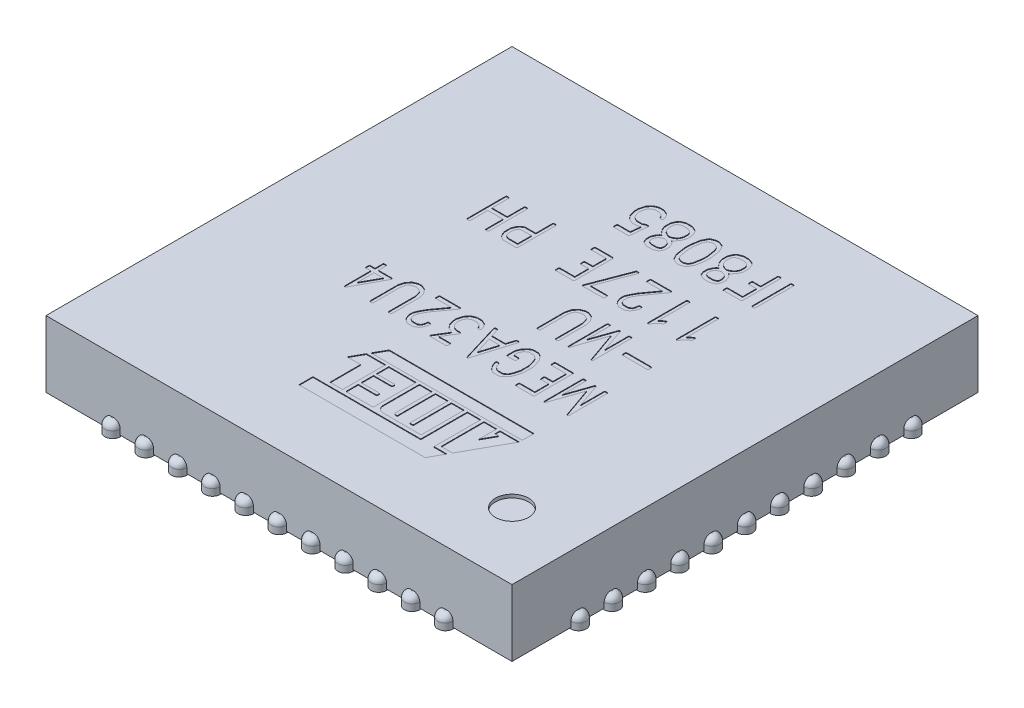
from build123d import *

# Parameters (mm, degrees)
SKETCH1_W              = 7
SKETCH1_H              = 7
BOSS_EXTRUDE1_DEPTH    = 1
SKETCH4_R              = 0.25
CUT_EXTRUDE1_DEPTH     = 0.05
CUT_EXTRUDE3_DEPTH     = 0.01
CUT_EXTRUDE6_DEPTH     = 0.01
CUT_EXTRUDE5_DEPTH     = 0.01
CUT_EXTRUDE9_DEPTH     = 0.01
CUT_EXTRUDE10_DEPTH    = 0.01
SKETCH11_W             = 5.2
SKETCH11_H             = 5.2
BOSS_EXTRUDE2_DEPTH    = 0.02
BOSS_EXTRUDE3_DEPTH    = 0.2
BOSS_EXTRUDE4_DEPTH    = 0.2
FILLET1_R              = 0.1
FILLET2_R              = 0.1
LPATTERN3_COUNT        = 11
LPATTERN3_PITCH        = 0.5
FILLET1_OF_LPATTERN3_R = 0.1
LPATTERN4_COUNT        = 11
LPATTERN4_PITCH        = 0.5
FILLET2_OF_LPATTERN4_R = 0.1
CHAMFER1_SIZE          = 0.3


with BuildPart() as part:
    # Sketch1 → Boss-Extrude1 (new body)
    with BuildSketch(Plane(origin=(0, 0, 0), x_dir=(-1, 0, 0), z_dir=(0, 1, 0))):
        Rectangle(SKETCH1_W, SKETCH1_H)
    extrude(amount=BOSS_EXTRUDE1_DEPTH)

    # Sketch4 → Cut-Extrude1 (cut)
    with BuildSketch(Plane(origin=(0, 1, 0), x_dir=(1, 0, 0), z_dir=(0, 1, 0))):
        with Locations((2.5, -2.5)):
            Circle(SKETCH4_R)
    extrude(amount=-CUT_EXTRUDE1_DEPTH, mode=Mode.SUBTRACT)

    # Sketch8 → Cut-Extrude3 (cut)
    with BuildSketch(Plane(origin=(0, 1, 0), x_dir=(1, 0, 0), z_dir=(0, 1, 0))):
        Polygon((-0.31, -1.59), (-0.597452825, -1.59), (-0.7, -1.775), (-0.5, -1.775), (-0.5, -2.235), (-0.31, -2.235), align=None)
        Polygon((-0.572508918, -1.545), (1.7, -1.545), (1.7, -1.37), (-0.475504834, -1.37), align=None)
        with BuildLine():
            Line((-0.26, -1.59), (-0.26, -1.775))
            Line((-0.26, -1.775), (0.005, -1.775))
            ThreePointArc((0.005, -1.775), (0.015606602, -1.779393398), (0.02, -1.79))
            Line((0.02, -1.79), (0.02, -1.805))
            ThreePointArc((0.02, -1.805), (0.015606602, -1.815606602), (0.005, -1.82))
            Line((0.005, -1.82), (-0.26, -1.82))
            Line((-0.26, -1.82), (-0.26, -2.005))
            Line((-0.26, -2.005), (0.005, -2.005))
            ThreePointArc((0.005, -2.005), (0.015606602, -2.009393398), (0.02, -2.02))
            Line((0.02, -2.02), (0.02, -2.035))
            ThreePointArc((0.02, -2.035), (0.015606602, -2.045606602), (0.005, -2.05))
            Line((0.005, -2.05), (-0.26, -2.05))
            Line((-0.26, -2.05), (-0.26, -2.235))
            Line((-0.26, -2.235), (0.15, -2.235))
            Line((0.15, -2.235), (0.15, -1.59))
            Line((0.15, -1.59), (-0.26, -1.59))
        make_face()
        Polygon((0.92, -2.29), (-0.7, -2.29), (-0.7, -2.5), (1.195578763, -2.5), (1.311983664, -2.29), (1.12, -2.29), (1.12, -1.59), (0.92, -1.59), align=None)
        Polygon((1.342470662, -2.235), (1.7, -1.59), (1.41, -1.59), (1.41, -1.665), (1.465, -1.665), (1.36, -1.854425014), (1.36, -1.59), (1.17, -1.59), (1.17, -2.235), align=None)
        with BuildLine():
            ThreePointArc((0.2, -2.135), (0.229289322, -2.205710678), (0.3, -2.235))
            Line((0.3, -2.235), (0.87, -2.235))
            Line((0.87, -2.235), (0.87, -1.59))
            Line((0.87, -1.59), (0.68, -1.59))
            Line((0.68, -1.59), (0.68, -2.155))
            ThreePointArc((0.68, -2.155), (0.677071068, -2.162071068), (0.67, -2.165))
            Line((0.67, -2.165), (0.64, -2.165))
            ThreePointArc((0.64, -2.165), (0.632928932, -2.162071068), (0.63, -2.155))
            Line((0.63, -2.155), (0.63, -1.59))
            Line((0.63, -1.59), (0.44, -1.59))
            Line((0.44, -1.59), (0.44, -2.165))
            Line((0.44, -2.165), (0.42, -2.165))
            ThreePointArc((0.42, -2.165), (0.398786797, -2.156213203), (0.39, -2.135))
            Line((0.39, -2.135), (0.39, -1.59))
            Line((0.39, -1.59), (0.2, -1.59))
            Line((0.2, -1.59), (0.2, -2.135))
        make_face()
    extrude(amount=-CUT_EXTRUDE3_DEPTH, mode=Mode.SUBTRACT)

    # Sketch9 → Cut-Extrude6 (cut)
    # profile 1 of 8: a face of its own
    with BuildSketch(Plane(origin=(0, 1, 0), x_dir=(1, 0, 0), z_dir=(0, 1, 0))):
        with BuildLine():
            Line((1.701897321, -0.87421875), (1.543191964, -0.422879464))
            Line((1.543191964, -0.422879464), (1.541183036, -0.425334821))
            Line((1.541183036, -0.425334821), (1.38125, -0.880022321))
            add(Edge.make_bspline(
                [(1.38125, -0.880022321), (1.379693283, -0.881667826), (1.376668535, -0.88486509), (1.372314217, -0.885436808), (1.370200893, -0.885714286)],
                knots=[0, 0, 0, 0, 1.029320271, 2, 2, 2, 2], degree=3))
            add(Edge.make_bspline(
                [(1.370200893, -0.885714286), (1.369258996, -0.885700986), (1.367687546, -0.885678798), (1.36621495, -0.885146346), (1.365625, -0.884933036)],
                knots=[0, 0, 0, 0, 1.198762811, 2, 2, 2, 2], degree=3))
            add(Edge.make_bspline(
                [(1.365625, -0.884933036), (1.364585033, -0.884467608), (1.362576708, -0.8835688), (1.360136277, -0.881268395), (1.358176341, -0.878479829), (1.357493648, -0.876254869), (1.357142857, -0.875111607)],
                knots=[0, 0, 0, 0, 1.006089285, 1.94290214, 2.942991381, 4, 4, 4, 4], degree=3))
            Line((1.357142857, -0.875111607), (1.357142857, -0.855580357))
            Line((1.357142857, -0.855580357), (1.357142857, -0.297991071))
            add(Edge.make_bspline(
                [(1.357142857, -0.297991071), (1.357426536, -0.296710829), (1.357980747, -0.294209678), (1.359672969, -0.290757464), (1.362216658, -0.287931414), (1.36425657, -0.286459894), (1.365290179, -0.285714286)],
                knots=[0, 0, 0, 0, 1.032778835, 2.01769381, 2.995579864, 4, 4, 4, 4], degree=3))
            Line((1.365290179, -0.285714286), (1.39765625, -0.285714286))
            add(Edge.make_bspline(
                [(1.39765625, -0.285714286), (1.398539913, -0.286035217), (1.400348424, -0.286692039), (1.402600065, -0.288699847), (1.404429101, -0.291410324), (1.405320676, -0.293507165), (1.405803571, -0.294642857)],
                knots=[0, 0, 0, 0, 0.892106066, 1.825791923, 2.822403661, 4, 4, 4, 4], degree=3))
            Line((1.405803571, -0.294642857), (1.407142857, -0.302678571))
            Line((1.407142857, -0.302678571), (1.407142857, -0.647433036))
            Line((1.407142857, -0.647433036), (1.531584821, -0.29296875))
            add(Edge.make_bspline(
                [(1.531584821, -0.29296875), (1.532446931, -0.291900324), (1.534072298, -0.289885979), (1.536855599, -0.287422233), (1.539982383, -0.28599011), (1.542137786, -0.285804879), (1.543191964, -0.285714286)],
                knots=[0, 0, 0, 0, 1.158246252, 2.183685773, 3.111665676, 4, 4, 4, 4], degree=3))
            add(Edge.make_bspline(
                [(1.543191964, -0.285714286), (1.544709209, -0.285824086), (1.547687476, -0.286039617), (1.551721664, -0.288371161), (1.554823551, -0.292157785), (1.556043009, -0.295301903), (1.556696429, -0.296986607)],
                knots=[0, 0, 0, 0, 0.953966103, 1.872582269, 2.860071235, 4, 4, 4, 4], degree=3))
            Line((1.556696429, -0.296986607), (1.678571429, -0.647433036))
            Line((1.678571429, -0.647433036), (1.678571429, -0.296986607))
            add(Edge.make_bspline(
                [(1.678571429, -0.296986607), (1.679471562, -0.294896244), (1.681116652, -0.291075885), (1.685429088, -0.287773161), (1.689476487, -0.286754279), (1.693235306, -0.286032458), (1.697802517, -0.285782685), (1.701116493, -0.285738233), (1.702901786, -0.285714286)],
                knots=[0, 0, 0, 0, 1.387598353, 2.535982921, 3.182758982, 3.953118769, 4.897311594, 6, 6, 6, 6], degree=3))
            Line((1.702901786, -0.285714286), (1.719754464, -0.285714286))
            add(Edge.make_bspline(
                [(1.719754464, -0.285714286), (1.721521765, -0.286903504), (1.725472535, -0.289561981), (1.727468384, -0.293912543), (1.728571429, -0.296316964)],
                knots=[0, 0, 0, 0, 0.894661657, 2, 2, 2, 2], degree=3))
            Line((1.728571429, -0.296316964), (1.728571429, -0.31015625))
            Line((1.728571429, -0.31015625), (1.728571429, -0.87265625))
            add(Edge.make_bspline(
                [(1.728571429, -0.87265625), (1.728144768, -0.874057386), (1.727352392, -0.876659517), (1.725393495, -0.879986724), (1.72305979, -0.882618587), (1.721059579, -0.883575826), (1.720089286, -0.884040179)],
                knots=[0, 0, 0, 0, 1.189307796, 2.20873289, 3.131064228, 4, 4, 4, 4], degree=3))
            add(Edge.make_bspline(
                [(1.720089286, -0.884040179), (1.719215605, -0.884514659), (1.717405913, -0.88549747), (1.715349391, -0.885640373), (1.714285714, -0.885714286)],
                knots=[0, 0, 0, 0, 0.965557051, 2, 2, 2, 2], degree=3))
            add(Edge.make_bspline(
                [(1.714285714, -0.885714286), (1.713217588, -0.885569288), (1.711042318, -0.885273997), (1.707915507, -0.883125442), (1.704989792, -0.879267595), (1.703050555, -0.876101549), (1.701897321, -0.87421875)],
                knots=[0, 0, 0, 0, 0.724309195, 1.475075939, 2.498466512, 4, 4, 4, 4], degree=3))
        make_face()
    # profile 2 of 8: a face of its own
    with BuildSketch(Plane(origin=(0, 1, 0), x_dir=(1, 0, 0), z_dir=(0, 1, 0))):
        with BuildLine():
            add(Edge.make_bspline(
                [(0.938727679, -0.884821429), (0.937927156, -0.884736785), (0.936316535, -0.884566486), (0.934132174, -0.883059763), (0.93265133, -0.880561998), (0.930858255, -0.875881516), (0.929898172, -0.867996406), (0.929763427, -0.861268677), (0.9296875, -0.857477679)],
                knots=[0, 0, 0, 0, 0.458930941, 0.92335228, 1.465177174, 2.111000206, 3.808592728, 6, 6, 6, 6], degree=3))
            Line((0.9296875, -0.857477679), (0.9296875, -0.83515625))
            add(Edge.make_bspline(
                [(0.9296875, -0.83515625), (0.930405588, -0.832535419), (0.931732149, -0.827693823), (0.935609783, -0.824546368), (0.937388393, -0.823102679)],
                knots=[0, 0, 0, 0, 1.082630928, 2, 2, 2, 2], degree=3))
            Line((0.937388393, -0.823102679), (0.943861607, -0.821428571))
            Line((0.943861607, -0.821428571), (1.164285714, -0.821428571))
            Line((1.164285714, -0.821428571), (1.164285714, -0.614285714))
            Line((1.164285714, -0.614285714), (1.046316964, -0.614285714))
            add(Edge.make_bspline(
                [(1.046316964, -0.614285714), (1.045539038, -0.614044377), (1.04381591, -0.613509807), (1.041800869, -0.611266825), (1.039685274, -0.608392665), (1.038571301, -0.60601899), (1.037946429, -0.6046875)],
                knots=[0, 0, 0, 0, 0.730957828, 1.619092074, 2.664453419, 4, 4, 4, 4], degree=3))
            add(Edge.make_bspline(
                [(1.037946429, -0.6046875), (1.037739496, -0.603387725), (1.037280275, -0.600503291), (1.037034396, -0.59572337), (1.036789917, -0.590106772), (1.036743611, -0.586086797), (1.03671875, -0.583928571)],
                knots=[0, 0, 0, 0, 0.758257029, 1.682708873, 2.755903774, 4, 4, 4, 4], degree=3))
            add(Edge.make_bspline(
                [(1.03671875, -0.583928571), (1.036713822, -0.581398773), (1.036704762, -0.576748082), (1.03676008, -0.570459271), (1.037079339, -0.565472888), (1.037120447, -0.560664957), (1.038997604, -0.555286173), (1.042551329, -0.552991894), (1.044419643, -0.551785714)],
                knots=[0, 0, 0, 0, 1.303816242, 2.396889211, 3.2414061, 3.875301435, 4.882973714, 6, 6, 6, 6], degree=3))
            Line((1.044419643, -0.551785714), (1.05078125, -0.55))
            Line((1.05078125, -0.55), (1.164285714, -0.55))
            Line((1.164285714, -0.55), (1.164285714, -0.35))
            Line((1.164285714, -0.35), (0.938727679, -0.35))
            add(Edge.make_bspline(
                [(0.938727679, -0.35), (0.937726257, -0.349492079), (0.935686849, -0.348457692), (0.933220777, -0.345925118), (0.931345002, -0.342621082), (0.930702946, -0.340090578), (0.930357143, -0.338727679)],
                knots=[0, 0, 0, 0, 0.916389236, 1.866239751, 2.850781764, 4, 4, 4, 4], degree=3))
            add(Edge.make_bspline(
                [(0.930357143, -0.338727679), (0.930224108, -0.336272911), (0.929925946, -0.330771201), (0.929966896, -0.32164997), (0.929598427, -0.310790598), (0.92965634, -0.302976589), (0.9296875, -0.298772321)],
                knots=[0, 0, 0, 0, 0.737996034, 1.654022555, 2.737764626, 4, 4, 4, 4], degree=3))
            add(Edge.make_bspline(
                [(0.9296875, -0.298772321), (0.93054106, -0.296201862), (0.932062292, -0.291620737), (0.935375975, -0.288136418), (0.936830357, -0.286607143)],
                knots=[0, 0, 0, 0, 1.122196084, 2, 2, 2, 2], degree=3))
            Line((0.936830357, -0.286607143), (0.94140625, -0.285714286))
            Line((0.94140625, -0.285714286), (1.205803571, -0.285714286))
            add(Edge.make_bspline(
                [(1.205803571, -0.285714286), (1.207538769, -0.286903345), (1.21141704, -0.289560964), (1.213264716, -0.293912417), (1.214285714, -0.296316964)],
                knots=[0, 0, 0, 0, 0.894830418, 2, 2, 2, 2], degree=3))
            Line((1.214285714, -0.296316964), (1.214285714, -0.31015625))
            Line((1.214285714, -0.31015625), (1.214285714, -0.8734375))
            add(Edge.make_bspline(
                [(1.214285714, -0.8734375), (1.213913718, -0.874844357), (1.213188906, -0.877585533), (1.210866816, -0.881122543), (1.207736442, -0.883928348), (1.205209471, -0.885106621), (1.20390625, -0.885714286)],
                knots=[0, 0, 0, 0, 1.034608711, 2.015872402, 2.976736403, 4, 4, 4, 4], degree=3))
            Line((1.20390625, -0.885714286), (0.938727679, -0.884821429))
        make_face()
    # profile 3 of 8: a face of its own
    with BuildSketch(Plane(origin=(0, 1, 0), x_dir=(1, 0, 0), z_dir=(0, 1, 0))):
        with BuildLine():
            Line((0.546875, -0.853459821), (0.501339286, -0.794642857))
            Line((0.501339286, -0.794642857), (0.478571429, -0.734151786))
            add(Edge.make_bspline(
                [(0.478571429, -0.734151786), (0.478590901, -0.731282412), (0.478623862, -0.726425349), (0.480408183, -0.721929254), (0.481138393, -0.720089286)],
                knots=[0, 0, 0, 0, 1.181526168, 2, 2, 2, 2], degree=3))
            add(Edge.make_bspline(
                [(0.481138393, -0.720089286), (0.482170475, -0.718957456), (0.484186902, -0.716746147), (0.488048515, -0.714317952), (0.492487567, -0.71281149), (0.495671912, -0.712679816), (0.497321429, -0.712611607)],
                knots=[0, 0, 0, 0, 0.991719859, 1.937568686, 2.931644178, 4, 4, 4, 4], degree=3))
            add(Edge.make_bspline(
                [(0.497321429, -0.712611607), (0.498401316, -0.71267559), (0.501351992, -0.712850416), (0.506396788, -0.713553854), (0.512245937, -0.714279579), (0.517076809, -0.714770138), (0.520663184, -0.715684459), (0.522824626, -0.717532791), (0.524643738, -0.720062835), (0.525455485, -0.722110822), (0.525892857, -0.723214286)],
                knots=[0, 0, 0, 0, 0.792010749, 2.164084151, 3.728773214, 5.104358871, 5.733381581, 6.392937359, 7.134108636, 8, 8, 8, 8], degree=3))
            Line((0.525892857, -0.723214286), (0.5453125, -0.774330357))
            Line((0.5453125, -0.774330357), (0.566071429, -0.798660714))
            Line((0.566071429, -0.798660714), (0.603013393, -0.821428571))
            Line((0.603013393, -0.821428571), (0.68203125, -0.821428571))
            Line((0.68203125, -0.821428571), (0.720200893, -0.797321429))
            Line((0.720200893, -0.797321429), (0.7390625, -0.773214286))
            add(Edge.make_bspline(
                [(0.7390625, -0.773214286), (0.740617025, -0.76976692), (0.743929669, -0.762420693), (0.748584829, -0.750415858), (0.753318377, -0.736846443), (0.758280242, -0.72176449), (0.763094446, -0.70508057), (0.768306196, -0.686928939), (0.773357487, -0.6671302), (0.776791082, -0.653423827), (0.778571429, -0.646316964)],
                knots=[0, 0, 0, 0, 0.681852536, 1.453006361, 2.320821465, 3.273390224, 4.315664321, 5.451898179, 6.67878895, 8, 8, 8, 8], degree=3))
            Line((0.778571429, -0.646316964), (0.778571429, -0.5203125))
            add(Edge.make_bspline(
                [(0.778571429, -0.5203125), (0.777378901, -0.516034805), (0.775129673, -0.507966634), (0.771980846, -0.496551794), (0.769299491, -0.486460627), (0.767012948, -0.477739796), (0.76496022, -0.470385507), (0.763279813, -0.464407934), (0.762047562, -0.459757847), (0.761417375, -0.457106585), (0.761160714, -0.456026786)],
                knots=[0, 0, 0, 0, 1.60019962, 3.018140744, 4.266793676, 5.362603539, 6.266752397, 7.018056806, 7.600076455, 8, 8, 8, 8], degree=3))
            add(Edge.make_bspline(
                [(0.761160714, -0.456026786), (0.759263066, -0.450321859), (0.755585516, -0.439265987), (0.749628474, -0.423387699), (0.743684474, -0.40870071), (0.739430052, -0.399427709), (0.737388393, -0.394977679)],
                knots=[0, 0, 0, 0, 1.100461683, 2.132641582, 3.103871418, 4, 4, 4, 4], degree=3))
            Line((0.737388393, -0.394977679), (0.718638393, -0.372433036))
            Line((0.718638393, -0.372433036), (0.68125, -0.35))
            Line((0.68125, -0.35), (0.603348214, -0.35))
            Line((0.603348214, -0.35), (0.564620536, -0.373772321))
            Line((0.564620536, -0.373772321), (0.546651786, -0.39765625))
            Line((0.546651786, -0.39765625), (0.528571429, -0.442857143))
            Line((0.528571429, -0.442857143), (0.528571429, -0.5))
            Line((0.528571429, -0.5), (0.603571429, -0.5))
            add(Edge.make_bspline(
                [(0.603571429, -0.5), (0.605532292, -0.500982731), (0.609341168, -0.502891636), (0.611167474, -0.506730963), (0.612053571, -0.50859375)],
                knots=[0, 0, 0, 0, 1.029628582, 2, 2, 2, 2], degree=3))
            Line((0.612053571, -0.50859375), (0.613950893, -0.513727679))
            Line((0.613950893, -0.513727679), (0.61328125, -0.551450893))
            add(Edge.make_bspline(
                [(0.61328125, -0.551450893), (0.61292265, -0.552771868), (0.612253571, -0.555236558), (0.610535498, -0.558488776), (0.608304843, -0.56105843), (0.606398454, -0.562102458), (0.60546875, -0.562611607)],
                knots=[0, 0, 0, 0, 1.16021269, 2.164737494, 3.104982886, 4, 4, 4, 4], degree=3))
            Line((0.60546875, -0.562611607), (0.598883929, -0.564285714))
            Line((0.598883929, -0.564285714), (0.488392857, -0.564285714))
            add(Edge.make_bspline(
                [(0.488392857, -0.564285714), (0.486215881, -0.563096332), (0.482062959, -0.560827399), (0.480150847, -0.556515752), (0.479241071, -0.554464286)],
                knots=[0, 0, 0, 0, 1.048407128, 2, 2, 2, 2], degree=3))
            Line((0.479241071, -0.554464286), (0.478571429, -0.545424107))
            Line((0.478571429, -0.545424107), (0.478571429, -0.433147321))
            Line((0.478571429, -0.433147321), (0.503348214, -0.371763393))
            Line((0.503348214, -0.371763393), (0.549441964, -0.315178571))
            Line((0.549441964, -0.315178571), (0.596316964, -0.285714286))
            Line((0.596316964, -0.285714286), (0.689955357, -0.285714286))
            Line((0.689955357, -0.285714286), (0.738169643, -0.315848214))
            Line((0.738169643, -0.315848214), (0.784375, -0.374553571))
            Line((0.784375, -0.374553571), (0.807700893, -0.435714286))
            Line((0.807700893, -0.435714286), (0.828571429, -0.515625))
            Line((0.828571429, -0.515625), (0.828571429, -0.657477679))
            Line((0.828571429, -0.657477679), (0.805133929, -0.743080357))
            Line((0.805133929, -0.743080357), (0.783035714, -0.79765625))
            Line((0.783035714, -0.79765625), (0.734933036, -0.856361607))
            Line((0.734933036, -0.856361607), (0.689955357, -0.884933036))
            Line((0.689955357, -0.884933036), (0.68671875, -0.885714286))
            Line((0.68671875, -0.885714286), (0.594977679, -0.884933036))
            Line((0.594977679, -0.884933036), (0.546875, -0.853459821))
        make_face()
    # profile 4 of 8: a face of its own
    with BuildSketch(Plane(origin=(0, 1, 0), x_dir=(1, 0, 0), z_dir=(0, 1, 0))):
        with BuildLine():
            Line((0.201004464, -0.875111607), (0.028571429, -0.305245536))
            add(Edge.make_bspline(
                [(0.028571429, -0.305245536), (0.028604981, -0.303605305), (0.028667087, -0.300569213), (0.029341685, -0.296367964), (0.030367546, -0.292885038), (0.032023263, -0.290088676), (0.034359209, -0.287950538), (0.037592866, -0.286672679), (0.041538591, -0.285738731), (0.04448645, -0.285722911), (0.04609375, -0.285714286)],
                knots=[0, 0, 0, 0, 1.274690765, 2.359471932, 3.302146231, 4.081389353, 4.860094881, 5.715183441, 6.754219054, 8, 8, 8, 8], degree=3))
            Line((0.04609375, -0.285714286), (0.067633929, -0.285714286))
            add(Edge.make_bspline(
                [(0.067633929, -0.285714286), (0.069305088, -0.286722574), (0.07283566, -0.288852735), (0.074911304, -0.29242609), (0.076004464, -0.294308036)],
                knots=[0, 0, 0, 0, 0.946678752, 2, 2, 2, 2], degree=3))
            Line((0.076004464, -0.294308036), (0.114397321, -0.414285714))
            Line((0.114397321, -0.414285714), (0.313504464, -0.414285714))
            Line((0.313504464, -0.414285714), (0.353125, -0.292633929))
            add(Edge.make_bspline(
                [(0.353125, -0.292633929), (0.354042004, -0.291573431), (0.355903027, -0.289421195), (0.359644485, -0.287220524), (0.364018223, -0.285945918), (0.36710341, -0.28579489), (0.36875, -0.285714286)],
                knots=[0, 0, 0, 0, 0.943850325, 1.915505833, 2.887487564, 4, 4, 4, 4], degree=3))
            add(Edge.make_bspline(
                [(0.36875, -0.285714286), (0.369977679, -0.285714286), (0.373028274, -0.285714286), (0.376078869, -0.285714286), (0.377901786, -0.285714286)],
                knots=[0, 0, 0, 0, 0.804878049, 2, 2, 2, 2], degree=3))
            add(Edge.make_bspline(
                [(0.377901786, -0.285714286), (0.380133929, -0.285714286), (0.384263393, -0.285714286), (0.388392857, -0.285714286), (0.390290179, -0.285714286)],
                knots=[0, 0, 0, 0, 1.081081081, 2, 2, 2, 2], degree=3))
            add(Edge.make_bspline(
                [(0.390290179, -0.285714286), (0.391780043, -0.286141285), (0.39471491, -0.286982425), (0.397963455, -0.290736147), (0.39983611, -0.295888478), (0.399941682, -0.299831041), (0.4, -0.302008929)],
                knots=[0, 0, 0, 0, 0.879221665, 1.731968348, 2.747130038, 4, 4, 4, 4], degree=3))
            add(Edge.make_bspline(
                [(0.4, -0.302008929), (0.400014173, -0.303205111), (0.400040068, -0.305390517), (0.399551505, -0.307518783), (0.399330357, -0.308482143)],
                knots=[0, 0, 0, 0, 1.094700372, 2, 2, 2, 2], degree=3))
            Line((0.399330357, -0.308482143), (0.225669643, -0.877566964))
            add(Edge.make_bspline(
                [(0.225669643, -0.877566964), (0.224936324, -0.878791731), (0.223579822, -0.881057322), (0.221018656, -0.883708604), (0.218197225, -0.885316638), (0.216236918, -0.885584784), (0.215290179, -0.885714286)],
                knots=[0, 0, 0, 0, 1.238763462, 2.291482334, 3.174862637, 4, 4, 4, 4], degree=3))
            add(Edge.make_bspline(
                [(0.215290179, -0.885714286), (0.213736863, -0.885599864), (0.210708179, -0.885376762), (0.206623865, -0.883169737), (0.20317963, -0.879754488), (0.201765952, -0.876737), (0.201004464, -0.875111607)],
                knots=[0, 0, 0, 0, 0.976753616, 1.904492135, 2.87123923, 4, 4, 4, 4], degree=3))
        make_face()
        Polygon((0.294308036, -0.478571429), (0.134821429, -0.478571429), (0.214508929, -0.736160714), align=None, mode=Mode.SUBTRACT)
    # profile 5 of 8: a face of its own
    with BuildSketch(Plane(origin=(0, 1, 0), x_dir=(1, 0, 0), z_dir=(0, 1, 0))):
        with BuildLine():
            add(Edge.make_bspline(
                [(-0.354129464, -0.875892857), (-0.354696577, -0.874649005), (-0.355750667, -0.872337062), (-0.355939532, -0.869807172), (-0.356026786, -0.868638393)],
                knots=[0, 0, 0, 0, 1.076023302, 2, 2, 2, 2], degree=3))
            add(Edge.make_bspline(
                [(-0.356026786, -0.868638393), (-0.356015111, -0.867148739), (-0.355994513, -0.864520444), (-0.354693217, -0.862254139), (-0.354129464, -0.861272321)],
                knots=[0, 0, 0, 0, 1.133551798, 2, 2, 2, 2], degree=3))
            Line((-0.354129464, -0.861272321), (-0.236049107, -0.669977679))
            Line((-0.236049107, -0.669977679), (-0.306026786, -0.641517857))
            add(Edge.make_bspline(
                [(-0.306026786, -0.641517857), (-0.314279062, -0.631423328), (-0.330794493, -0.611220965), (-0.346942834, -0.590723988), (-0.355022321, -0.58046875)],
                knots=[0, 0, 0, 0, 0.999341394, 2, 2, 2, 2], degree=3))
            add(Edge.make_bspline(
                [(-0.355022321, -0.58046875), (-0.355238528, -0.579462623), (-0.35573723, -0.577141895), (-0.356793481, -0.573172938), (-0.358143479, -0.568200953), (-0.359637574, -0.562135301), (-0.361743564, -0.555151287), (-0.363882306, -0.547067945), (-0.36664821, -0.538074279), (-0.368464569, -0.531699951), (-0.369419643, -0.528348214)],
                knots=[0, 0, 0, 0, 0.456636029, 1.053274216, 1.822173105, 2.743172303, 3.824904862, 5.058612241, 6.453365246, 8, 8, 8, 8], degree=3))
            add(Edge.make_bspline(
                [(-0.369419643, -0.528348214), (-0.370835788, -0.523381305), (-0.373552991, -0.513851138), (-0.37624308, -0.49983961), (-0.378244163, -0.486887387), (-0.378465626, -0.47854099), (-0.378571429, -0.474553571)],
                knots=[0, 0, 0, 0, 1.131644974, 2.171323215, 3.126365663, 4, 4, 4, 4], degree=3))
            add(Edge.make_bspline(
                [(-0.378571429, -0.474553571), (-0.378571429, -0.473474702), (-0.378571429, -0.470758929), (-0.378571429, -0.468043155), (-0.378571429, -0.46640625)],
                knots=[0, 0, 0, 0, 0.794520548, 2, 2, 2, 2], degree=3))
            add(Edge.make_bspline(
                [(-0.378571429, -0.46640625), (-0.378213626, -0.464916071), (-0.377559116, -0.462190163), (-0.378255664, -0.459485174), (-0.378571429, -0.458258929)],
                knots=[0, 0, 0, 0, 1.093345258, 2, 2, 2, 2], degree=3))
            Line((-0.378571429, -0.458258929), (-0.355803571, -0.375223214))
            add(Edge.make_bspline(
                [(-0.355803571, -0.375223214), (-0.347724084, -0.364967976), (-0.331575743, -0.344470999), (-0.315060312, -0.324268636), (-0.306808036, -0.314174107)],
                knots=[0, 0, 0, 0, 1.000658606, 2, 2, 2, 2], degree=3))
            Line((-0.306808036, -0.314174107), (-0.236495536, -0.285714286))
            Line((-0.236495536, -0.285714286), (-0.166741071, -0.285714286))
            Line((-0.166741071, -0.285714286), (-0.099553571, -0.314397321))
            Line((-0.099553571, -0.314397321), (-0.074107143, -0.344754464))
            Line((-0.074107143, -0.344754464), (-0.05, -0.403794643))
            add(Edge.make_bspline(
                [(-0.05, -0.403794643), (-0.050068204, -0.40550413), (-0.050195955, -0.408706132), (-0.050463368, -0.413168888), (-0.051562066, -0.416767627), (-0.052715042, -0.419747087), (-0.054597261, -0.422029562), (-0.057253448, -0.423515406), (-0.060550085, -0.42437234), (-0.062977895, -0.424490123), (-0.064285714, -0.424553571)],
                knots=[0, 0, 0, 0, 1.403751092, 2.629334449, 3.642786757, 4.475492558, 5.232786981, 6.011861082, 6.929023956, 8, 8, 8, 8], degree=3))
            add(Edge.make_bspline(
                [(-0.064285714, -0.424553571), (-0.064624224, -0.424490611), (-0.065521984, -0.424323636), (-0.066341913, -0.423915166), (-0.066852679, -0.423660714)],
                knots=[0, 0, 0, 0, 0.754121326, 2, 2, 2, 2], degree=3))
            add(Edge.make_bspline(
                [(-0.066852679, -0.423660714), (-0.067485119, -0.423660714), (-0.068787202, -0.423660714), (-0.070870536, -0.423660714), (-0.073474702, -0.423660714), (-0.075409226, -0.423660714), (-0.0765625, -0.423660714)],
                knots=[0, 0, 0, 0, 0.781609195, 1.609195402, 2.574712644, 4, 4, 4, 4], degree=3))
            add(Edge.make_bspline(
                [(-0.0765625, -0.423660714), (-0.077673511, -0.42391882), (-0.079586736, -0.424363292), (-0.081544981, -0.424497358), (-0.082366071, -0.424553571)],
                knots=[0, 0, 0, 0, 1.161401177, 2, 2, 2, 2], degree=3))
            add(Edge.make_bspline(
                [(-0.082366071, -0.424553571), (-0.08405778, -0.424467775), (-0.087206668, -0.424308075), (-0.091517325, -0.422562065), (-0.094811023, -0.419531066), (-0.096029792, -0.416870965), (-0.096651786, -0.415513393)],
                knots=[0, 0, 0, 0, 1.115803358, 2.076918325, 3.01856323, 4, 4, 4, 4], degree=3))
            Line((-0.096651786, -0.415513393), (-0.111607143, -0.382366071))
            add(Edge.make_bspline(
                [(-0.111607143, -0.382366071), (-0.1135995, -0.380296972), (-0.117602906, -0.376139361), (-0.12466988, -0.370933716), (-0.132317037, -0.366281961), (-0.143583847, -0.361616973), (-0.157695721, -0.356354242), (-0.168937282, -0.352088712), (-0.174441964, -0.35)],
                knots=[0, 0, 0, 0, 0.722339423, 1.451455844, 2.203636052, 2.971531708, 4.517042502, 6, 6, 6, 6], degree=3))
            Line((-0.174441964, -0.35), (-0.233482143, -0.35))
            Line((-0.233482143, -0.35), (-0.272433036, -0.366741071))
            Line((-0.272433036, -0.366741071), (-0.296986607, -0.387388393))
            Line((-0.296986607, -0.387388393), (-0.316517857, -0.422321429))
            add(Edge.make_bspline(
                [(-0.316517857, -0.422321429), (-0.316722668, -0.423775526), (-0.317209539, -0.427232163), (-0.31861205, -0.433205418), (-0.320909077, -0.440722125), (-0.322686327, -0.446282079), (-0.323660714, -0.449330357)],
                knots=[0, 0, 0, 0, 0.629569103, 1.496592513, 2.627491761, 4, 4, 4, 4], degree=3))
            add(Edge.make_bspline(
                [(-0.323660714, -0.449330357), (-0.324444744, -0.45211108), (-0.325939926, -0.457414056), (-0.327454157, -0.465144402), (-0.328577461, -0.47217759), (-0.32872492, -0.476670348), (-0.328794643, -0.478794643)],
                knots=[0, 0, 0, 0, 1.155307442, 2.203228349, 3.150438965, 4, 4, 4, 4], degree=3))
            add(Edge.make_bspline(
                [(-0.328794643, -0.478794643), (-0.328783482, -0.481180189), (-0.32876618, -0.484878183), (-0.328292952, -0.488543057), (-0.328125, -0.48984375)],
                knots=[0, 0, 0, 0, 1.29018418, 2, 2, 2, 2], degree=3))
            Line((-0.328125, -0.48984375), (-0.314508929, -0.538392857))
            Line((-0.314508929, -0.538392857), (-0.296986607, -0.569308036))
            Line((-0.296986607, -0.569308036), (-0.269754464, -0.590848214))
            Line((-0.269754464, -0.590848214), (-0.230803571, -0.605915179))
            Line((-0.230803571, -0.605915179), (-0.167299107, -0.605915179))
            add(Edge.make_bspline(
                [(-0.167299107, -0.605915179), (-0.166423081, -0.606164703), (-0.164618673, -0.606678665), (-0.162106259, -0.608509744), (-0.160099005, -0.611408883), (-0.158903382, -0.61364075), (-0.158258929, -0.61484375)],
                knots=[0, 0, 0, 0, 0.823563072, 1.696346785, 2.758306337, 4, 4, 4, 4], degree=3))
            add(Edge.make_bspline(
                [(-0.158258929, -0.61484375), (-0.15786933, -0.616323305), (-0.157155394, -0.619034575), (-0.156993287, -0.621831879), (-0.156919643, -0.623102679)],
                knots=[0, 0, 0, 0, 1.091411048, 2, 2, 2, 2], degree=3))
            add(Edge.make_bspline(
                [(-0.156919643, -0.623102679), (-0.15703191, -0.625154102), (-0.157253043, -0.629194774), (-0.159198493, -0.632740851), (-0.16015625, -0.634486607)],
                knots=[0, 0, 0, 0, 1.01538692, 2, 2, 2, 2], degree=3))
            Line((-0.16015625, -0.634486607), (-0.275558036, -0.821428571))
            Line((-0.275558036, -0.821428571), (-0.101227679, -0.821428571))
            add(Edge.make_bspline(
                [(-0.101227679, -0.821428571), (-0.100185629, -0.821890838), (-0.098101531, -0.822815372), (-0.095648827, -0.825259442), (-0.093772465, -0.828285012), (-0.09309938, -0.830594123), (-0.092745536, -0.831808036)],
                knots=[0, 0, 0, 0, 0.971732718, 1.943465435, 2.918868049, 4, 4, 4, 4], degree=3))
            Line((-0.092745536, -0.831808036), (-0.092745536, -0.871763393))
            add(Edge.make_bspline(
                [(-0.092745536, -0.871763393), (-0.093147286, -0.87323247), (-0.093883937, -0.875926175), (-0.095520345, -0.879386041), (-0.097035271, -0.882229193), (-0.098546568, -0.883405419), (-0.09921875, -0.883928571)],
                knots=[0, 0, 0, 0, 1.297513627, 2.379125606, 3.279081171, 4, 4, 4, 4], degree=3))
            Line((-0.09921875, -0.883928571), (-0.103794643, -0.884821429))
            Line((-0.103794643, -0.884821429), (-0.318415179, -0.885714286))
            add(Edge.make_bspline(
                [(-0.318415179, -0.885714286), (-0.319196429, -0.885714286), (-0.321130952, -0.885714286), (-0.323065476, -0.885714286), (-0.32421875, -0.885714286)],
                knots=[0, 0, 0, 0, 0.807692308, 2, 2, 2, 2], degree=3))
            add(Edge.make_bspline(
                [(-0.32421875, -0.885714286), (-0.325297619, -0.885714286), (-0.327901786, -0.885714286), (-0.330505952, -0.885714286), (-0.33203125, -0.885714286)],
                knots=[0, 0, 0, 0, 0.828571429, 2, 2, 2, 2], degree=3))
            add(Edge.make_bspline(
                [(-0.33203125, -0.885714286), (-0.333556548, -0.885714286), (-0.336160714, -0.885714286), (-0.338764881, -0.885714286), (-0.33984375, -0.885714286)],
                knots=[0, 0, 0, 0, 1.171428571, 2, 2, 2, 2], degree=3))
            add(Edge.make_bspline(
                [(-0.33984375, -0.885714286), (-0.341536742, -0.885590371), (-0.344698868, -0.885358925), (-0.349047745, -0.883494841), (-0.352325687, -0.880196997), (-0.353514269, -0.877360825), (-0.354129464, -0.875892857)],
                knots=[0, 0, 0, 0, 1.088184808, 2.03248379, 2.981637811, 4, 4, 4, 4], degree=3))
        make_face()
    # profile 6 of 8: a face of its own
    with BuildSketch(Plane(origin=(0, 1, 0), x_dir=(1, 0, 0), z_dir=(0, 1, 0))):
        with BuildLine():
            Line((-0.738169643, -0.854129464), (-0.762946429, -0.8234375))
            Line((-0.762946429, -0.8234375), (-0.785714286, -0.765178571))
            Line((-0.785714286, -0.765178571), (-0.785714286, -0.705245536))
            Line((-0.785714286, -0.705245536), (-0.784375, -0.698772321))
            Line((-0.784375, -0.698772321), (-0.761607143, -0.64375))
            Line((-0.761607143, -0.64375), (-0.71796875, -0.562834821))
            Line((-0.71796875, -0.562834821), (-0.563504464, -0.35))
            Line((-0.563504464, -0.35), (-0.797544643, -0.35))
            add(Edge.make_bspline(
                [(-0.797544643, -0.35), (-0.798925664, -0.34896043), (-0.80178653, -0.3468069), (-0.804732351, -0.3417949), (-0.806333668, -0.335441902), (-0.806496266, -0.330777165), (-0.806584821, -0.328236607)],
                knots=[0, 0, 0, 0, 0.835533444, 1.730855502, 2.764154603, 4, 4, 4, 4], degree=3))
            add(Edge.make_bspline(
                [(-0.806584821, -0.328236607), (-0.806514282, -0.327008663), (-0.806332466, -0.323843614), (-0.806073608, -0.320683862), (-0.805915179, -0.31875)],
                knots=[0, 0, 0, 0, 0.775940213, 2, 2, 2, 2], degree=3))
            add(Edge.make_bspline(
                [(-0.805915179, -0.31875), (-0.805745198, -0.316220179), (-0.80541272, -0.311271924), (-0.805750225, -0.306324351), (-0.805915179, -0.30390625)],
                knots=[0, 0, 0, 0, 1.022510555, 2, 2, 2, 2], degree=3))
            add(Edge.make_bspline(
                [(-0.805915179, -0.30390625), (-0.805836427, -0.302146966), (-0.805688416, -0.29884043), (-0.804411577, -0.294262746), (-0.802490329, -0.290312365), (-0.800436025, -0.288417102), (-0.799441964, -0.2875)],
                knots=[0, 0, 0, 0, 1.156160642, 2.172979539, 3.115919479, 4, 4, 4, 4], degree=3))
            Line((-0.799441964, -0.2875), (-0.795535714, -0.285714286))
            Line((-0.795535714, -0.285714286), (-0.48828125, -0.285714286))
            add(Edge.make_bspline(
                [(-0.48828125, -0.285714286), (-0.486949695, -0.28624784), (-0.484303277, -0.287308262), (-0.481346727, -0.290863487), (-0.479380656, -0.29554804), (-0.478855806, -0.29915936), (-0.478571429, -0.301116071)],
                knots=[0, 0, 0, 0, 0.877497478, 1.743995249, 2.777634855, 4, 4, 4, 4], degree=3))
            add(Edge.make_bspline(
                [(-0.478571429, -0.301116071), (-0.478716983, -0.303663896), (-0.478995475, -0.308538676), (-0.481352543, -0.312806516), (-0.482477679, -0.31484375)],
                knots=[0, 0, 0, 0, 1.045308762, 2, 2, 2, 2], degree=3))
            Line((-0.482477679, -0.31484375), (-0.676785714, -0.58515625))
            add(Edge.make_bspline(
                [(-0.676785714, -0.58515625), (-0.68218006, -0.595126488), (-0.69296875, -0.615066964), (-0.70375744, -0.63500744), (-0.709151786, -0.644977679)],
                knots=[0, 0, 0, 0, 1, 2, 2, 2, 2], degree=3))
            add(Edge.make_bspline(
                [(-0.709151786, -0.644977679), (-0.712113441, -0.650827598), (-0.71777665, -0.662013678), (-0.724957415, -0.678499227), (-0.731162974, -0.693604199), (-0.734251933, -0.703474564), (-0.735714286, -0.708147321)],
                knots=[0, 0, 0, 0, 1.146390494, 2.192101283, 3.14411757, 4, 4, 4, 4], degree=3))
            Line((-0.735714286, -0.708147321), (-0.735714286, -0.754241071))
            Line((-0.735714286, -0.754241071), (-0.717633929, -0.799553571))
            Line((-0.717633929, -0.799553571), (-0.681361607, -0.821428571))
            Line((-0.681361607, -0.821428571), (-0.60234375, -0.821428571))
            Line((-0.60234375, -0.821428571), (-0.566071429, -0.797879464))
            Line((-0.566071429, -0.797879464), (-0.54921875, -0.75234375))
            Line((-0.54921875, -0.75234375), (-0.54921875, -0.733705357))
            add(Edge.make_bspline(
                [(-0.54921875, -0.733705357), (-0.549126914, -0.731458073), (-0.548957348, -0.727308661), (-0.547363215, -0.721687198), (-0.544882388, -0.716991511), (-0.542165757, -0.715094259), (-0.540848214, -0.714174107)],
                knots=[0, 0, 0, 0, 1.209701834, 2.233608353, 3.143314783, 4, 4, 4, 4], degree=3))
            add(Edge.make_bspline(
                [(-0.540848214, -0.714174107), (-0.538989904, -0.713960195), (-0.534652714, -0.713460937), (-0.530285957, -0.713417617), (-0.527790179, -0.713392857)],
                knots=[0, 0, 0, 0, 0.856918679, 2, 2, 2, 2], degree=3))
            add(Edge.make_bspline(
                [(-0.527790179, -0.713392857), (-0.524215958, -0.713409415), (-0.518177955, -0.713437387), (-0.512163852, -0.713960609), (-0.509709821, -0.714174107)],
                knots=[0, 0, 0, 0, 1.183907999, 2, 2, 2, 2], degree=3))
            add(Edge.make_bspline(
                [(-0.509709821, -0.714174107), (-0.508091426, -0.714905493), (-0.504827402, -0.716380573), (-0.50140739, -0.721188425), (-0.499658367, -0.727554523), (-0.499446698, -0.732315972), (-0.499330357, -0.734933036)],
                knots=[0, 0, 0, 0, 0.844617517, 1.703447207, 2.737732144, 4, 4, 4, 4], degree=3))
            add(Edge.make_bspline(
                [(-0.499330357, -0.734933036), (-0.499189694, -0.735973958), (-0.49877888, -0.739014026), (-0.499111576, -0.742073147), (-0.499330357, -0.744084821)],
                knots=[0, 0, 0, 0, 0.68480177, 2, 2, 2, 2], degree=3))
            add(Edge.make_bspline(
                [(-0.499330357, -0.744084821), (-0.499497891, -0.746539332), (-0.499835262, -0.751482087), (-0.499944838, -0.756435142), (-0.5, -0.758928571)],
                knots=[0, 0, 0, 0, 0.993175091, 2, 2, 2, 2], degree=3))
            Line((-0.5, -0.758928571), (-0.501227679, -0.76640625))
            Line((-0.501227679, -0.76640625), (-0.5234375, -0.822767857))
            Line((-0.5234375, -0.822767857), (-0.55078125, -0.856696429))
            add(Edge.make_bspline(
                [(-0.55078125, -0.856696429), (-0.553707341, -0.858577588), (-0.560240372, -0.862777619), (-0.57137601, -0.86921039), (-0.584331244, -0.877255721), (-0.593808655, -0.882764347), (-0.598883929, -0.885714286)],
                knots=[0, 0, 0, 0, 0.742919736, 1.658703783, 2.746206184, 4, 4, 4, 4], degree=3))
            Line((-0.598883929, -0.885714286), (-0.690066964, -0.884933036))
            Line((-0.690066964, -0.884933036), (-0.738169643, -0.854129464))
        make_face()
    # profile 7 of 8: a face of its own
    with BuildSketch(Plane(origin=(0, 1, 0), x_dir=(1, 0, 0), z_dir=(0, 1, 0))):
        with BuildLine():
            add(Edge.make_bspline(
                [(-0.969196429, -0.885714286), (-0.970901457, -0.884806209), (-0.974634281, -0.882818152), (-0.97631767, -0.878909193), (-0.977232143, -0.876785714)],
                knots=[0, 0, 0, 0, 0.913532566, 2, 2, 2, 2], degree=3))
            Line((-0.977232143, -0.876785714), (-0.978571429, -0.86875))
            Line((-0.978571429, -0.86875), (-0.978571429, -0.468303571))
            Line((-0.978571429, -0.468303571), (-0.998549107, -0.395424107))
            Line((-0.998549107, -0.395424107), (-1.015290179, -0.374330357))
            Line((-1.015290179, -0.374330357), (-1.07578125, -0.35))
            Line((-1.07578125, -0.35), (-1.113727679, -0.35))
            Line((-1.113727679, -0.35), (-1.17109375, -0.374330357))
            Line((-1.17109375, -0.374330357), (-1.188504464, -0.396986607))
            Line((-1.188504464, -0.396986607), (-1.207142857, -0.473214286))
            Line((-1.207142857, -0.473214286), (-1.207142857, -0.874330357))
            add(Edge.make_bspline(
                [(-1.207142857, -0.874330357), (-1.207535859, -0.875580877), (-1.208285959, -0.877967669), (-1.210239856, -0.881098), (-1.212845256, -0.883548811), (-1.214994201, -0.884470839), (-1.216071429, -0.884933036)],
                knots=[0, 0, 0, 0, 1.084856827, 2.070602267, 3.032827531, 4, 4, 4, 4], degree=3))
            add(Edge.make_bspline(
                [(-1.216071429, -0.884933036), (-1.218078705, -0.885146787), (-1.222862977, -0.885656255), (-1.227675409, -0.885692973), (-1.23046875, -0.885714286)],
                knots=[0, 0, 0, 0, 0.839114555, 2, 2, 2, 2], degree=3))
            Line((-1.23046875, -0.885714286), (-1.248214286, -0.885714286))
            add(Edge.make_bspline(
                [(-1.248214286, -0.885714286), (-1.249291513, -0.885252089), (-1.251440459, -0.884330061), (-1.254045858, -0.88187925), (-1.255999755, -0.878748919), (-1.256749855, -0.876362127), (-1.257142857, -0.875111607)],
                knots=[0, 0, 0, 0, 0.967172469, 1.929397733, 2.915143173, 4, 4, 4, 4], degree=3))
            Line((-1.257142857, -0.875111607), (-1.257142857, -0.858816964))
            Line((-1.257142857, -0.858816964), (-1.257142857, -0.459375))
            Line((-1.257142857, -0.459375), (-1.235044643, -0.376227679))
            add(Edge.make_bspline(
                [(-1.235044643, -0.376227679), (-1.232085106, -0.372271431), (-1.22555452, -0.36354148), (-1.214390809, -0.349462029), (-1.201181936, -0.332958523), (-1.1914656, -0.321298906), (-1.186272321, -0.315066964)],
                knots=[0, 0, 0, 0, 0.757781203, 1.672138476, 2.755782776, 4, 4, 4, 4], degree=3))
            add(Edge.make_bspline(
                [(-1.186272321, -0.315066964), (-1.179354586, -0.312123455), (-1.166161767, -0.306509885), (-1.147427916, -0.298621095), (-1.130701806, -0.291735311), (-1.120206422, -0.287634967), (-1.115290179, -0.285714286)],
                knots=[0, 0, 0, 0, 1.174438592, 2.239773021, 3.175475223, 4, 4, 4, 4], degree=3))
            Line((-1.115290179, -0.285714286), (-1.0671875, -0.285714286))
            Line((-1.0671875, -0.285714286), (-1.00078125, -0.314174107))
            add(Edge.make_bspline(
                [(-1.00078125, -0.314174107), (-0.996896706, -0.31869976), (-0.988864109, -0.328058065), (-0.976760252, -0.342775787), (-0.964068841, -0.358527273), (-0.955666097, -0.369548217), (-0.951339286, -0.375223214)],
                knots=[0, 0, 0, 0, 0.910855234, 1.883498667, 2.910153342, 4, 4, 4, 4], degree=3))
            Line((-0.951339286, -0.375223214), (-0.928571429, -0.461607143))
            Line((-0.928571429, -0.461607143), (-0.928571429, -0.87265625))
            add(Edge.make_bspline(
                [(-0.928571429, -0.87265625), (-0.929234894, -0.874609546), (-0.930479014, -0.878272331), (-0.934126925, -0.882779474), (-0.939315431, -0.885382455), (-0.943162316, -0.885599348), (-0.945200893, -0.885714286)],
                knots=[0, 0, 0, 0, 1.0700366, 2.006513326, 2.943592741, 4, 4, 4, 4], degree=3))
            add(Edge.make_bspline(
                [(-0.945200893, -0.885714286), (-0.946540179, -0.885714286), (-0.950111607, -0.885714286), (-0.953683036, -0.885714286), (-0.955915179, -0.885714286)],
                knots=[0, 0, 0, 0, 0.75, 2, 2, 2, 2], degree=3))
            add(Edge.make_bspline(
                [(-0.955915179, -0.885714286), (-0.958258929, -0.885714286), (-0.962686012, -0.885714286), (-0.967113095, -0.885714286), (-0.969196429, -0.885714286)],
                knots=[0, 0, 0, 0, 1.058823529, 2, 2, 2, 2], degree=3))
        make_face()
    # profile 8 of 8: a face of its own
    with BuildSketch(Plane(origin=(0, 1, 0), x_dir=(1, 0, 0), z_dir=(0, 1, 0))):
        with BuildLine():
            add(Edge.make_bspline(
                [(-1.638950893, -0.881584821), (-1.640076152, -0.879207005), (-1.642415573, -0.874263511), (-1.642706271, -0.868796964), (-1.642857143, -0.865959821)],
                knots=[0, 0, 0, 0, 0.961998562, 2, 2, 2, 2], degree=3))
            Line((-1.642857143, -0.865959821), (-1.642857143, -0.478571429))
            Line((-1.642857143, -0.478571429), (-1.717745536, -0.478571429))
            add(Edge.make_bspline(
                [(-1.717745536, -0.478571429), (-1.719814027, -0.47737451), (-1.723652848, -0.475153202), (-1.725338642, -0.471076473), (-1.726116071, -0.469196429)],
                knots=[0, 0, 0, 0, 1.077669981, 2, 2, 2, 2], degree=3))
            add(Edge.make_bspline(
                [(-1.726116071, -0.469196429), (-1.726682199, -0.465743896), (-1.727893855, -0.458354596), (-1.727971843, -0.450865132), (-1.728013393, -0.446875)],
                knots=[0, 0, 0, 0, 0.934468093, 2, 2, 2, 2], degree=3))
            add(Edge.make_bspline(
                [(-1.728013393, -0.446875), (-1.727946385, -0.445423638), (-1.727788176, -0.4419969), (-1.727506262, -0.438578001), (-1.72734375, -0.436607143)],
                knots=[0, 0, 0, 0, 0.847080496, 2, 2, 2, 2], degree=3))
            add(Edge.make_bspline(
                [(-1.72734375, -0.436607143), (-1.727159845, -0.43482076), (-1.726833992, -0.431655546), (-1.72718907, -0.428496626), (-1.72734375, -0.427120536)],
                knots=[0, 0, 0, 0, 1.128759324, 2, 2, 2, 2], degree=3))
            add(Edge.make_bspline(
                [(-1.72734375, -0.427120536), (-1.7265323, -0.424582454), (-1.725129465, -0.420194621), (-1.721662457, -0.417215648), (-1.720200893, -0.415959821)],
                knots=[0, 0, 0, 0, 1.15687269, 2, 2, 2, 2], degree=3))
            Line((-1.720200893, -0.415959821), (-1.7125, -0.414285714))
            Line((-1.7125, -0.414285714), (-1.642857143, -0.414285714))
            Line((-1.642857143, -0.414285714), (-1.642857143, -0.296651786))
            add(Edge.make_bspline(
                [(-1.642857143, -0.296651786), (-1.641944248, -0.294263466), (-1.640250425, -0.289832081), (-1.636458204, -0.287013689), (-1.634709821, -0.285714286)],
                knots=[0, 0, 0, 0, 1.077911376, 2, 2, 2, 2], degree=3))
            Line((-1.634709821, -0.285714286), (-1.60234375, -0.285714286))
            add(Edge.make_bspline(
                [(-1.60234375, -0.285714286), (-1.600594363, -0.286533664), (-1.596785051, -0.288317871), (-1.595104957, -0.292205669), (-1.594196429, -0.294308036)],
                knots=[0, 0, 0, 0, 0.918479413, 2, 2, 2, 2], degree=3))
            Line((-1.594196429, -0.294308036), (-1.592857143, -0.300558036))
            Line((-1.592857143, -0.300558036), (-1.592857143, -0.414285714))
            Line((-1.592857143, -0.414285714), (-1.38828125, -0.414285714))
            add(Edge.make_bspline(
                [(-1.38828125, -0.414285714), (-1.386945678, -0.414692067), (-1.384273545, -0.415505073), (-1.381385815, -0.418970254), (-1.379317002, -0.42353213), (-1.378838049, -0.427127836), (-1.378571429, -0.429129464)],
                knots=[0, 0, 0, 0, 0.862857035, 1.726352042, 2.734324542, 4, 4, 4, 4], degree=3))
            Line((-1.378571429, -0.429129464), (-1.379910714, -0.4390625))
            Line((-1.379910714, -0.4390625), (-1.619419643, -0.881584821))
            add(Edge.make_bspline(
                [(-1.619419643, -0.881584821), (-1.620640561, -0.882802548), (-1.62316499, -0.885320377), (-1.626730399, -0.88558015), (-1.628571429, -0.885714286)],
                knots=[0, 0, 0, 0, 0.967282998, 2, 2, 2, 2], degree=3))
            add(Edge.make_bspline(
                [(-1.628571429, -0.885714286), (-1.630586651, -0.885578454), (-1.63449779, -0.885314831), (-1.637497022, -0.882802613), (-1.638950893, -0.881584821)],
                knots=[0, 0, 0, 0, 1.030504549, 2, 2, 2, 2], degree=3))
        make_face()
        Polygon((-1.455022321, -0.478571429), (-1.592857143, -0.478571429), (-1.592857143, -0.728794643), align=None, mode=Mode.SUBTRACT)
    extrude(amount=-CUT_EXTRUDE6_DEPTH, mode=Mode.SUBTRACT)

    # Sketch10 → Cut-Extrude5 (cut)
    with BuildSketch(Plane(origin=(0, 1, 0), x_dir=(1, 0, 0), z_dir=(0, 1, 0))):
        with BuildLine():
            add(Edge.make_bspline(
                [(1.34609375, 0.315178571), (1.344249533, 0.315998065), (1.340303628, 0.31775146), (1.338183046, 0.321534282), (1.337053571, 0.323549107)],
                knots=[0, 0, 0, 0, 0.934749858, 2, 2, 2, 2], degree=3))
            add(Edge.make_bspline(
                [(1.337053571, 0.323549107), (1.336665845, 0.327601004), (1.335990772, 0.33465579), (1.335796835, 0.341739335), (1.335714286, 0.344754464)],
                knots=[0, 0, 0, 0, 1.148694626, 2, 2, 2, 2], degree=3))
            add(Edge.make_bspline(
                [(1.335714286, 0.344754464), (1.335714286, 0.34624256), (1.335714286, 0.349888393), (1.335714286, 0.353534226), (1.335714286, 0.355691964)],
                knots=[0, 0, 0, 0, 0.816326531, 2, 2, 2, 2], degree=3))
            add(Edge.make_bspline(
                [(1.335714286, 0.355691964), (1.335903607, 0.357664555), (1.336228873, 0.361053589), (1.335865963, 0.364434969), (1.335714286, 0.365848214)],
                knots=[0, 0, 0, 0, 1.164101931, 2, 2, 2, 2], degree=3))
            add(Edge.make_bspline(
                [(1.335714286, 0.365848214), (1.336267677, 0.367840654), (1.337490079, 0.372241814), (1.340958761, 0.375250623), (1.342857143, 0.376897321)],
                knots=[0, 0, 0, 0, 0.905415618, 2, 2, 2, 2], degree=3))
            Line((1.342857143, 0.376897321), (1.348772321, 0.378571429))
            Line((1.348772321, 0.378571429), (1.718861607, 0.378571429))
            add(Edge.make_bspline(
                [(1.718861607, 0.378571429), (1.720381135, 0.377918921), (1.723589694, 0.376541118), (1.726602174, 0.371332625), (1.728417887, 0.364500349), (1.728516353, 0.359209433), (1.728571429, 0.35625)],
                knots=[0, 0, 0, 0, 0.74472197, 1.572517798, 2.642206628, 4, 4, 4, 4], degree=3))
            Line((1.728571429, 0.35625), (1.728571429, 0.333147321))
            add(Edge.make_bspline(
                [(1.728571429, 0.333147321), (1.728476802, 0.331504096), (1.728298017, 0.32839943), (1.727176853, 0.323913567), (1.725069967, 0.320019052), (1.723075725, 0.317894207), (1.722098214, 0.316852679)],
                knots=[0, 0, 0, 0, 1.093679931, 2.066368886, 3.052198653, 4, 4, 4, 4], degree=3))
            add(Edge.make_bspline(
                [(1.722098214, 0.316852679), (1.720943169, 0.316125409), (1.71893756, 0.314862586), (1.716611475, 0.314457506), (1.715625, 0.314285714)],
                knots=[0, 0, 0, 0, 1.151815252, 2, 2, 2, 2], degree=3))
            Line((1.715625, 0.314285714), (1.34609375, 0.315178571))
        make_face()
        with BuildLine():
            Line((1.166183036, 0.02578125), (1.007477679, 0.477120536))
            Line((1.007477679, 0.477120536), (1.00546875, 0.474665179))
            Line((1.00546875, 0.474665179), (0.845535714, 0.019977679))
            add(Edge.make_bspline(
                [(0.845535714, 0.019977679), (0.843978997, 0.018332174), (0.840954249, 0.01513491), (0.836599931, 0.014563192), (0.834486607, 0.014285714)],
                knots=[0, 0, 0, 0, 1.029320271, 2, 2, 2, 2], degree=3))
            add(Edge.make_bspline(
                [(0.834486607, 0.014285714), (0.83354471, 0.014299014), (0.831973261, 0.014321202), (0.830500664, 0.014853654), (0.829910714, 0.015066964)],
                knots=[0, 0, 0, 0, 1.198762811, 2, 2, 2, 2], degree=3))
            add(Edge.make_bspline(
                [(0.829910714, 0.015066964), (0.828870747, 0.015532392), (0.826862422, 0.0164312), (0.824421991, 0.018731605), (0.822462055, 0.021520171), (0.821779363, 0.023745131), (0.821428571, 0.024888393)],
                knots=[0, 0, 0, 0, 1.006089285, 1.94290214, 2.942991381, 4, 4, 4, 4], degree=3))
            Line((0.821428571, 0.024888393), (0.821428571, 0.044419643))
            Line((0.821428571, 0.044419643), (0.821428571, 0.602008929))
            add(Edge.make_bspline(
                [(0.821428571, 0.602008929), (0.82171225, 0.603289171), (0.822266461, 0.605790322), (0.823958683, 0.609242536), (0.826502372, 0.612068586), (0.828542284, 0.613540106), (0.829575893, 0.614285714)],
                knots=[0, 0, 0, 0, 1.032778835, 2.01769381, 2.995579864, 4, 4, 4, 4], degree=3))
            Line((0.829575893, 0.614285714), (0.861941964, 0.614285714))
            add(Edge.make_bspline(
                [(0.861941964, 0.614285714), (0.862825627, 0.613964783), (0.864634138, 0.613307961), (0.86688578, 0.611300153), (0.868714815, 0.608589676), (0.86960639, 0.606492835), (0.870089286, 0.605357143)],
                knots=[0, 0, 0, 0, 0.892106066, 1.825791923, 2.822403661, 4, 4, 4, 4], degree=3))
            Line((0.870089286, 0.605357143), (0.871428571, 0.597321429))
            Line((0.871428571, 0.597321429), (0.871428571, 0.252566964))
            Line((0.871428571, 0.252566964), (0.995870536, 0.60703125))
            add(Edge.make_bspline(
                [(0.995870536, 0.60703125), (0.996732645, 0.608099676), (0.998358012, 0.610114021), (1.001141314, 0.612577767), (1.004268098, 0.61400989), (1.006423501, 0.614195121), (1.007477679, 0.614285714)],
                knots=[0, 0, 0, 0, 1.158246252, 2.183685773, 3.111665676, 4, 4, 4, 4], degree=3))
            add(Edge.make_bspline(
                [(1.007477679, 0.614285714), (1.008994923, 0.614175914), (1.01197319, 0.613960383), (1.016007378, 0.611628839), (1.019109265, 0.607842215), (1.020328724, 0.604698097), (1.020982143, 0.603013393)],
                knots=[0, 0, 0, 0, 0.953966103, 1.872582269, 2.860071235, 4, 4, 4, 4], degree=3))
            Line((1.020982143, 0.603013393), (1.142857143, 0.252566964))
            Line((1.142857143, 0.252566964), (1.142857143, 0.603013393))
            add(Edge.make_bspline(
                [(1.142857143, 0.603013393), (1.143757276, 0.605103756), (1.145402366, 0.608924115), (1.149714802, 0.612226839), (1.153762201, 0.613245721), (1.15752102, 0.613967542), (1.162088231, 0.614217315), (1.165402207, 0.614261767), (1.1671875, 0.614285714)],
                knots=[0, 0, 0, 0, 1.387598353, 2.535982921, 3.182758982, 3.953118769, 4.897311594, 6, 6, 6, 6], degree=3))
            Line((1.1671875, 0.614285714), (1.184040179, 0.614285714))
            add(Edge.make_bspline(
                [(1.184040179, 0.614285714), (1.18580748, 0.613096496), (1.18975825, 0.610438019), (1.191754099, 0.606087457), (1.192857143, 0.603683036)],
                knots=[0, 0, 0, 0, 0.894661657, 2, 2, 2, 2], degree=3))
            Line((1.192857143, 0.603683036), (1.192857143, 0.58984375))
            Line((1.192857143, 0.58984375), (1.192857143, 0.02734375))
            add(Edge.make_bspline(
                [(1.192857143, 0.02734375), (1.192430482, 0.025942614), (1.191638107, 0.023340483), (1.189679209, 0.020013276), (1.187345504, 0.017381413), (1.185345293, 0.016424174), (1.184375, 0.015959821)],
                knots=[0, 0, 0, 0, 1.189307796, 2.20873289, 3.131064228, 4, 4, 4, 4], degree=3))
            add(Edge.make_bspline(
                [(1.184375, 0.015959821), (1.183501319, 0.015485341), (1.181691627, 0.01450253), (1.179635106, 0.014359627), (1.178571429, 0.014285714)],
                knots=[0, 0, 0, 0, 0.965557051, 2, 2, 2, 2], degree=3))
            add(Edge.make_bspline(
                [(1.178571429, 0.014285714), (1.177503302, 0.014430712), (1.175328032, 0.014726003), (1.172201221, 0.016874558), (1.169275506, 0.020732405), (1.16733627, 0.023898451), (1.166183036, 0.02578125)],
                knots=[0, 0, 0, 0, 0.724309195, 1.475075939, 2.498466512, 4, 4, 4, 4], degree=3))
        make_face()
        with BuildLine():
            add(Edge.make_bspline(
                [(0.637946429, 0.014285714), (0.6362414, 0.015193791), (0.632508576, 0.017181848), (0.630825188, 0.021090807), (0.629910714, 0.023214286)],
                knots=[0, 0, 0, 0, 0.913532566, 2, 2, 2, 2], degree=3))
            Line((0.629910714, 0.023214286), (0.628571429, 0.03125))
            Line((0.628571429, 0.03125), (0.628571429, 0.431696429))
            Line((0.628571429, 0.431696429), (0.60859375, 0.504575893))
            Line((0.60859375, 0.504575893), (0.591852679, 0.525669643))
            Line((0.591852679, 0.525669643), (0.531361607, 0.55))
            Line((0.531361607, 0.55), (0.493415179, 0.55))
            Line((0.493415179, 0.55), (0.436049107, 0.525669643))
            Line((0.436049107, 0.525669643), (0.418638393, 0.503013393))
            Line((0.418638393, 0.503013393), (0.4, 0.426785714))
            Line((0.4, 0.426785714), (0.4, 0.025669643))
            add(Edge.make_bspline(
                [(0.4, 0.025669643), (0.399606998, 0.024419123), (0.398856898, 0.022032331), (0.396903001, 0.018902), (0.394297602, 0.016451189), (0.392148656, 0.015529161), (0.391071429, 0.015066964)],
                knots=[0, 0, 0, 0, 1.084856827, 2.070602267, 3.032827531, 4, 4, 4, 4], degree=3))
            add(Edge.make_bspline(
                [(0.391071429, 0.015066964), (0.389064152, 0.014853213), (0.38427988, 0.014343745), (0.379467448, 0.014307027), (0.376674107, 0.014285714)],
                knots=[0, 0, 0, 0, 0.839114555, 2, 2, 2, 2], degree=3))
            Line((0.376674107, 0.014285714), (0.358928571, 0.014285714))
            add(Edge.make_bspline(
                [(0.358928571, 0.014285714), (0.357851344, 0.014747911), (0.355702398, 0.015669939), (0.353096999, 0.01812075), (0.351143102, 0.021251081), (0.350393002, 0.023637873), (0.35, 0.024888393)],
                knots=[0, 0, 0, 0, 0.967172469, 1.929397733, 2.915143173, 4, 4, 4, 4], degree=3))
            Line((0.35, 0.024888393), (0.35, 0.041183036))
            Line((0.35, 0.041183036), (0.35, 0.440625))
            Line((0.35, 0.440625), (0.372098214, 0.523772321))
            add(Edge.make_bspline(
                [(0.372098214, 0.523772321), (0.375057751, 0.527728569), (0.381588338, 0.53645852), (0.392752048, 0.550537971), (0.405960922, 0.567041477), (0.415677258, 0.578701094), (0.420870536, 0.584933036)],
                knots=[0, 0, 0, 0, 0.757781203, 1.672138476, 2.755782776, 4, 4, 4, 4], degree=3))
            add(Edge.make_bspline(
                [(0.420870536, 0.584933036), (0.427788271, 0.587876545), (0.44098109, 0.593490115), (0.459714941, 0.601378905), (0.476441051, 0.608264689), (0.486936435, 0.612365033), (0.491852679, 0.614285714)],
                knots=[0, 0, 0, 0, 1.174438592, 2.239773021, 3.175475223, 4, 4, 4, 4], degree=3))
            Line((0.491852679, 0.614285714), (0.539955357, 0.614285714))
            Line((0.539955357, 0.614285714), (0.606361607, 0.585825893))
            add(Edge.make_bspline(
                [(0.606361607, 0.585825893), (0.610246151, 0.58130024), (0.618278748, 0.571941935), (0.630382605, 0.557224213), (0.643074017, 0.541472727), (0.65147676, 0.530451783), (0.655803571, 0.524776786)],
                knots=[0, 0, 0, 0, 0.910855234, 1.883498667, 2.910153342, 4, 4, 4, 4], degree=3))
            Line((0.655803571, 0.524776786), (0.678571429, 0.438392857))
            Line((0.678571429, 0.438392857), (0.678571429, 0.02734375))
            add(Edge.make_bspline(
                [(0.678571429, 0.02734375), (0.677907963, 0.025390454), (0.676663844, 0.021727669), (0.673015932, 0.017220526), (0.667827426, 0.014617545), (0.663980542, 0.014400652), (0.661941964, 0.014285714)],
                knots=[0, 0, 0, 0, 1.0700366, 2.006513326, 2.943592741, 4, 4, 4, 4], degree=3))
            add(Edge.make_bspline(
                [(0.661941964, 0.014285714), (0.660602679, 0.014285714), (0.65703125, 0.014285714), (0.653459821, 0.014285714), (0.651227679, 0.014285714)],
                knots=[0, 0, 0, 0, 0.75, 2, 2, 2, 2], degree=3))
            add(Edge.make_bspline(
                [(0.651227679, 0.014285714), (0.648883929, 0.014285714), (0.644456845, 0.014285714), (0.640029762, 0.014285714), (0.637946429, 0.014285714)],
                knots=[0, 0, 0, 0, 1.058823529, 2, 2, 2, 2], degree=3))
        make_face()
    extrude(amount=-CUT_EXTRUDE5_DEPTH, mode=Mode.SUBTRACT)

    # Sketch16 → Cut-Extrude9 (cut)
    # profile 1 of 7: a face of its own
    with BuildSketch(Plane(origin=(0, 1, 0), x_dir=(1, 0, 0), z_dir=(0, 1, 0))):
        with BuildLine():
            add(Edge.make_bspline(
                [(1.547767857, 0.91953125), (1.546336817, 0.921542176), (1.543302231, 0.925806436), (1.543011024, 0.931047477), (1.542857143, 0.933816964)],
                knots=[0, 0, 0, 0, 0.943153724, 2, 2, 2, 2], degree=3))
            Line((1.542857143, 0.933816964), (1.542857143, 1.502901786))
            add(Edge.make_bspline(
                [(1.542857143, 1.502901786), (1.54366988, 1.505378647), (1.545210886, 1.510074946), (1.549220946, 1.512934371), (1.551116071, 1.514285714)],
                knots=[0, 0, 0, 0, 1.05481425, 2, 2, 2, 2], degree=3))
            Line((1.551116071, 1.514285714), (1.583928571, 1.514285714))
            add(Edge.make_bspline(
                [(1.583928571, 1.514285714), (1.584999861, 1.513817002), (1.587114193, 1.512891938), (1.589795458, 1.510565554), (1.591707756, 1.507424982), (1.59246198, 1.505042765), (1.592857143, 1.503794643)],
                knots=[0, 0, 0, 0, 0.972168258, 1.918702339, 2.909539504, 4, 4, 4, 4], degree=3))
            Line((1.592857143, 1.503794643), (1.592857143, 1.487611607))
            Line((1.592857143, 1.487611607), (1.592857143, 1.03046875))
            Line((1.592857143, 1.03046875), (1.614732143, 1.057366071))
            Line((1.614732143, 1.057366071), (1.661830357, 1.085825893))
            add(Edge.make_bspline(
                [(1.661830357, 1.085825893), (1.663246546, 1.085752054), (1.66584346, 1.085616654), (1.669484677, 1.084885498), (1.672432186, 1.083414267), (1.674987626, 1.081229243), (1.6767208, 1.077465465), (1.677741174, 1.072075275), (1.678531239, 1.064716005), (1.678556962, 1.059154583), (1.678571429, 1.056026786)],
                knots=[0, 0, 0, 0, 0.853787321, 1.565619441, 2.216715773, 2.819394937, 3.550694807, 4.653687831, 6.118001623, 8, 8, 8, 8], degree=3))
            Line((1.678571429, 1.056026786), (1.678571429, 1.046875))
            add(Edge.make_bspline(
                [(1.678571429, 1.046875), (1.678499703, 1.044485347), (1.678367194, 1.040070624), (1.677097455, 1.034112048), (1.674905434, 1.029285676), (1.672546749, 1.027135433), (1.671428571, 1.026116071)],
                knots=[0, 0, 0, 0, 1.260445817, 2.328588702, 3.207636775, 4, 4, 4, 4], degree=3))
            Line((1.671428571, 1.026116071), (1.6296875, 0.999665179))
            Line((1.6296875, 0.999665179), (1.563727679, 0.916741071))
            add(Edge.make_bspline(
                [(1.563727679, 0.916741071), (1.562909884, 0.916053411), (1.561055595, 0.914494191), (1.558617365, 0.914360464), (1.557254464, 0.914285714)],
                knots=[0, 0, 0, 0, 0.882057335, 2, 2, 2, 2], degree=3))
            add(Edge.make_bspline(
                [(1.557254464, 0.914285714), (1.555625381, 0.914604481), (1.551928511, 0.915327858), (1.549260287, 0.91802349), (1.547767857, 0.91953125)],
                knots=[0, 0, 0, 0, 0.881330785, 2, 2, 2, 2], degree=3))
        make_face()
    # profile 2 of 7: a face of its own
    with BuildSketch(Plane(origin=(0, 1, 0), x_dir=(1, 0, 0), z_dir=(0, 1, 0))):
        with BuildLine():
            add(Edge.make_bspline(
                [(1.119196429, 0.91953125), (1.117765388, 0.921542176), (1.114730803, 0.925806436), (1.114439595, 0.931047477), (1.114285714, 0.933816964)],
                knots=[0, 0, 0, 0, 0.943153724, 2, 2, 2, 2], degree=3))
            Line((1.114285714, 0.933816964), (1.114285714, 1.502901786))
            add(Edge.make_bspline(
                [(1.114285714, 1.502901786), (1.115098452, 1.505378647), (1.116639457, 1.510074946), (1.120649517, 1.512934371), (1.122544643, 1.514285714)],
                knots=[0, 0, 0, 0, 1.05481425, 2, 2, 2, 2], degree=3))
            Line((1.122544643, 1.514285714), (1.155357143, 1.514285714))
            add(Edge.make_bspline(
                [(1.155357143, 1.514285714), (1.156428433, 1.513817002), (1.158542764, 1.512891938), (1.161224029, 1.510565554), (1.163136327, 1.507424982), (1.163890551, 1.505042765), (1.164285714, 1.503794643)],
                knots=[0, 0, 0, 0, 0.972168258, 1.918702339, 2.909539504, 4, 4, 4, 4], degree=3))
            Line((1.164285714, 1.503794643), (1.164285714, 1.487611607))
            Line((1.164285714, 1.487611607), (1.164285714, 1.03046875))
            Line((1.164285714, 1.03046875), (1.186160714, 1.057366071))
            Line((1.186160714, 1.057366071), (1.233258929, 1.085825893))
            add(Edge.make_bspline(
                [(1.233258929, 1.085825893), (1.234675117, 1.085752054), (1.237272031, 1.085616654), (1.240913248, 1.084885498), (1.243860758, 1.083414267), (1.246416197, 1.081229243), (1.248149372, 1.077465465), (1.249169745, 1.072075275), (1.24995981, 1.064716005), (1.249985533, 1.059154583), (1.25, 1.056026786)],
                knots=[0, 0, 0, 0, 0.853787321, 1.565619441, 2.216715773, 2.819394937, 3.550694807, 4.653687831, 6.118001623, 8, 8, 8, 8], degree=3))
            Line((1.25, 1.056026786), (1.25, 1.046875))
            add(Edge.make_bspline(
                [(1.25, 1.046875), (1.249928274, 1.044485347), (1.249795765, 1.040070624), (1.248526026, 1.034112048), (1.246334005, 1.029285676), (1.243975321, 1.027135433), (1.242857143, 1.026116071)],
                knots=[0, 0, 0, 0, 1.260445817, 2.328588702, 3.207636775, 4, 4, 4, 4], degree=3))
            Line((1.242857143, 1.026116071), (1.201116071, 0.999665179))
            Line((1.201116071, 0.999665179), (1.13515625, 0.916741071))
            add(Edge.make_bspline(
                [(1.13515625, 0.916741071), (1.134338455, 0.916053411), (1.132484166, 0.914494191), (1.130045936, 0.914360464), (1.128683036, 0.914285714)],
                knots=[0, 0, 0, 0, 0.882057335, 2, 2, 2, 2], degree=3))
            add(Edge.make_bspline(
                [(1.128683036, 0.914285714), (1.127053953, 0.914604481), (1.123357082, 0.915327858), (1.120688858, 0.91802349), (1.119196429, 0.91953125)],
                knots=[0, 0, 0, 0, 0.881330785, 2, 2, 2, 2], degree=3))
        make_face()
    # profile 3 of 7: a face of its own
    with BuildSketch(Plane(origin=(0, 1, 0), x_dir=(1, 0, 0), z_dir=(0, 1, 0))):
        with BuildLine():
            Line((0.633258929, 0.945870536), (0.608482143, 0.9765625))
            Line((0.608482143, 0.9765625), (0.585714286, 1.034821429))
            Line((0.585714286, 1.034821429), (0.585714286, 1.094754464))
            Line((0.585714286, 1.094754464), (0.587053571, 1.101227679))
            Line((0.587053571, 1.101227679), (0.609821429, 1.15625))
            Line((0.609821429, 1.15625), (0.653459821, 1.237165179))
            Line((0.653459821, 1.237165179), (0.807924107, 1.45))
            Line((0.807924107, 1.45), (0.573883929, 1.45))
            add(Edge.make_bspline(
                [(0.573883929, 1.45), (0.572502907, 1.45103957), (0.569642042, 1.4531931), (0.56669622, 1.4582051), (0.565094904, 1.464558098), (0.564932306, 1.469222835), (0.56484375, 1.471763393)],
                knots=[0, 0, 0, 0, 0.835533444, 1.730855502, 2.764154603, 4, 4, 4, 4], degree=3))
            add(Edge.make_bspline(
                [(0.56484375, 1.471763393), (0.564914289, 1.472991337), (0.565096106, 1.476156386), (0.565354964, 1.479316138), (0.565513393, 1.48125)],
                knots=[0, 0, 0, 0, 0.775940213, 2, 2, 2, 2], degree=3))
            add(Edge.make_bspline(
                [(0.565513393, 1.48125), (0.565683374, 1.483779821), (0.566015851, 1.488728076), (0.565678347, 1.493675649), (0.565513393, 1.49609375)],
                knots=[0, 0, 0, 0, 1.022510555, 2, 2, 2, 2], degree=3))
            add(Edge.make_bspline(
                [(0.565513393, 1.49609375), (0.565592144, 1.497853034), (0.565740155, 1.50115957), (0.567016995, 1.505737254), (0.568938243, 1.509687635), (0.570992546, 1.511582898), (0.571986607, 1.5125)],
                knots=[0, 0, 0, 0, 1.156160642, 2.172979539, 3.115919479, 4, 4, 4, 4], degree=3))
            Line((0.571986607, 1.5125), (0.575892857, 1.514285714))
            Line((0.575892857, 1.514285714), (0.883147321, 1.514285714))
            add(Edge.make_bspline(
                [(0.883147321, 1.514285714), (0.884478876, 1.51375216), (0.887125294, 1.512691738), (0.890081844, 1.509136513), (0.892047915, 1.50445196), (0.892572765, 1.50084064), (0.892857143, 1.498883929)],
                knots=[0, 0, 0, 0, 0.877497478, 1.743995249, 2.777634855, 4, 4, 4, 4], degree=3))
            add(Edge.make_bspline(
                [(0.892857143, 1.498883929), (0.892711588, 1.496336104), (0.892433096, 1.491461324), (0.890076029, 1.487193484), (0.888950893, 1.48515625)],
                knots=[0, 0, 0, 0, 1.045308762, 2, 2, 2, 2], degree=3))
            Line((0.888950893, 1.48515625), (0.694642857, 1.21484375))
            add(Edge.make_bspline(
                [(0.694642857, 1.21484375), (0.689248512, 1.204873512), (0.678459821, 1.184933036), (0.667671131, 1.16499256), (0.662276786, 1.155022321)],
                knots=[0, 0, 0, 0, 1, 2, 2, 2, 2], degree=3))
            add(Edge.make_bspline(
                [(0.662276786, 1.155022321), (0.65931513, 1.149172402), (0.653651921, 1.137986322), (0.646471156, 1.121500773), (0.640265598, 1.106395801), (0.637176639, 1.096525436), (0.635714286, 1.091852679)],
                knots=[0, 0, 0, 0, 1.146390494, 2.192101283, 3.14411757, 4, 4, 4, 4], degree=3))
            Line((0.635714286, 1.091852679), (0.635714286, 1.045758929))
            Line((0.635714286, 1.045758929), (0.653794643, 1.000446429))
            Line((0.653794643, 1.000446429), (0.690066964, 0.978571429))
            Line((0.690066964, 0.978571429), (0.769084821, 0.978571429))
            Line((0.769084821, 0.978571429), (0.805357143, 1.002120536))
            Line((0.805357143, 1.002120536), (0.822209821, 1.04765625))
            Line((0.822209821, 1.04765625), (0.822209821, 1.066294643))
            add(Edge.make_bspline(
                [(0.822209821, 1.066294643), (0.822301657, 1.068541927), (0.822471223, 1.072691339), (0.824065357, 1.078312802), (0.826546184, 1.083008489), (0.829262814, 1.084905741), (0.830580357, 1.085825893)],
                knots=[0, 0, 0, 0, 1.209701834, 2.233608353, 3.143314783, 4, 4, 4, 4], degree=3))
            add(Edge.make_bspline(
                [(0.830580357, 1.085825893), (0.832438667, 1.086039805), (0.836775858, 1.086539063), (0.841142614, 1.086582383), (0.843638393, 1.086607143)],
                knots=[0, 0, 0, 0, 0.856918679, 2, 2, 2, 2], degree=3))
            add(Edge.make_bspline(
                [(0.843638393, 1.086607143), (0.847212613, 1.086590585), (0.853250616, 1.086562613), (0.859264719, 1.086039391), (0.86171875, 1.085825893)],
                knots=[0, 0, 0, 0, 1.183907999, 2, 2, 2, 2], degree=3))
            add(Edge.make_bspline(
                [(0.86171875, 1.085825893), (0.863337146, 1.085094507), (0.866601169, 1.083619427), (0.870021181, 1.078811575), (0.871770204, 1.072445477), (0.871981873, 1.067684028), (0.872098214, 1.065066964)],
                knots=[0, 0, 0, 0, 0.844617517, 1.703447207, 2.737732144, 4, 4, 4, 4], degree=3))
            add(Edge.make_bspline(
                [(0.872098214, 1.065066964), (0.872238877, 1.064026042), (0.872649692, 1.060985974), (0.872316995, 1.057926853), (0.872098214, 1.055915179)],
                knots=[0, 0, 0, 0, 0.68480177, 2, 2, 2, 2], degree=3))
            add(Edge.make_bspline(
                [(0.872098214, 1.055915179), (0.87193068, 1.053460668), (0.871593309, 1.048517913), (0.871483733, 1.043564858), (0.871428571, 1.041071429)],
                knots=[0, 0, 0, 0, 0.993175091, 2, 2, 2, 2], degree=3))
            Line((0.871428571, 1.041071429), (0.870200893, 1.03359375))
            Line((0.870200893, 1.03359375), (0.847991071, 0.977232143))
            Line((0.847991071, 0.977232143), (0.820647321, 0.943303571))
            add(Edge.make_bspline(
                [(0.820647321, 0.943303571), (0.817721231, 0.941422412), (0.811188199, 0.937222381), (0.800052562, 0.93078961), (0.787097328, 0.922744279), (0.777619917, 0.917235653), (0.772544643, 0.914285714)],
                knots=[0, 0, 0, 0, 0.742919736, 1.658703783, 2.746206184, 4, 4, 4, 4], degree=3))
            Line((0.772544643, 0.914285714), (0.681361607, 0.915066964))
            Line((0.681361607, 0.915066964), (0.633258929, 0.945870536))
        make_face()
    # profile 4 of 7: a face of its own
    with BuildSketch(Plane(origin=(0, 1, 0), x_dir=(1, 0, 0), z_dir=(0, 1, 0))):
        with BuildLine():
            Line((0.135714286, 0.92890625), (0.136383929, 0.937053571))
            Line((0.136383929, 0.937053571), (0.35390625, 1.509375))
            add(Edge.make_bspline(
                [(0.35390625, 1.509375), (0.355454591, 1.510805915), (0.358747879, 1.513849443), (0.363243171, 1.514134616), (0.365625, 1.514285714)],
                knots=[0, 0, 0, 0, 0.940300582, 2, 2, 2, 2], degree=3))
            Line((0.365625, 1.514285714), (0.383816964, 1.514285714))
            add(Edge.make_bspline(
                [(0.383816964, 1.514285714), (0.386225946, 1.514125063), (0.390586371, 1.513834274), (0.396473913, 1.51094778), (0.399689368, 1.505354663), (0.399963499, 1.501153665), (0.400111607, 1.498883929)],
                knots=[0, 0, 0, 0, 1.127528817, 2.040905521, 2.941530565, 4, 4, 4, 4], degree=3))
            add(Edge.make_bspline(
                [(0.400111607, 1.498883929), (0.400075314, 1.498586209), (0.399952429, 1.497578175), (0.399636595, 1.495519751), (0.39886525, 1.492354647), (0.398453374, 1.489847954), (0.398214286, 1.488392857)],
                knots=[0, 0, 0, 0, 0.33748649, 1.142680576, 2.341369908, 4, 4, 4, 4], degree=3))
            Line((0.398214286, 1.488392857), (0.204352679, 0.978571429))
            Line((0.204352679, 0.978571429), (0.455245536, 0.978571429))
            add(Edge.make_bspline(
                [(0.455245536, 0.978571429), (0.456853051, 0.977525492), (0.460214853, 0.975338124), (0.462009782, 0.971742416), (0.462946429, 0.969866071)],
                knots=[0, 0, 0, 0, 0.956341824, 2, 2, 2, 2], degree=3))
            add(Edge.make_bspline(
                [(0.462946429, 0.969866071), (0.463132399, 0.967708403), (0.463481791, 0.963654681), (0.46396931, 0.958004465), (0.464176295, 0.953200708), (0.464251832, 0.950297689), (0.464285714, 0.948995536)],
                knots=[0, 0, 0, 0, 1.242369712, 2.334103953, 3.252759666, 4, 4, 4, 4], degree=3))
            add(Edge.make_bspline(
                [(0.464285714, 0.948995536), (0.464442199, 0.947321721), (0.464793267, 0.943566571), (0.464466711, 0.939807), (0.464285714, 0.937723214)],
                knots=[0, 0, 0, 0, 0.891476676, 2, 2, 2, 2], degree=3))
            add(Edge.make_bspline(
                [(0.464285714, 0.937723214), (0.464123646, 0.935715117), (0.463844696, 0.932258788), (0.46368358, 0.928795075), (0.463616071, 0.92734375)],
                knots=[0, 0, 0, 0, 1.16198313, 2, 2, 2, 2], degree=3))
            add(Edge.make_bspline(
                [(0.463616071, 0.92734375), (0.463262443, 0.925983912), (0.462610408, 0.923476588), (0.4608691, 0.920194612), (0.458639945, 0.917624525), (0.456733367, 0.916580551), (0.455803571, 0.916071429)],
                knots=[0, 0, 0, 0, 1.181497136, 2.178492941, 3.111691115, 4, 4, 4, 4], degree=3))
            Line((0.455803571, 0.916071429), (0.4421875, 0.915178571))
            Line((0.4421875, 0.915178571), (0.172767857, 0.914285714))
            add(Edge.make_bspline(
                [(0.172767857, 0.914285714), (0.171875, 0.914285714), (0.169494048, 0.914285714), (0.167113095, 0.914285714), (0.165625, 0.914285714)],
                knots=[0, 0, 0, 0, 0.75, 2, 2, 2, 2], degree=3))
            add(Edge.make_bspline(
                [(0.165625, 0.914285714), (0.164769345, 0.914285714), (0.162611607, 0.914285714), (0.160453869, 0.914285714), (0.159151786, 0.914285714)],
                knots=[0, 0, 0, 0, 0.793103448, 2, 2, 2, 2], degree=3))
            add(Edge.make_bspline(
                [(0.159151786, 0.914285714), (0.1578125, 0.914285714), (0.155431548, 0.914285714), (0.153050595, 0.914285714), (0.152008929, 0.914285714)],
                knots=[0, 0, 0, 0, 1.125, 2, 2, 2, 2], degree=3))
            add(Edge.make_bspline(
                [(0.152008929, 0.914285714), (0.149772834, 0.914402679), (0.145636155, 0.914619058), (0.140228603, 0.917634537), (0.136720036, 0.922687378), (0.136066487, 0.926728479), (0.135714286, 0.92890625)],
                knots=[0, 0, 0, 0, 1.087189606, 2.011253415, 2.928254212, 4, 4, 4, 4], degree=3))
        make_face()
    # profile 5 of 7: a face of its own
    with BuildSketch(Plane(origin=(0, 1, 0), x_dir=(1, 0, 0), z_dir=(0, 1, 0))):
        with BuildLine():
            add(Edge.make_bspline(
                [(-0.261272321, 0.915178571), (-0.262072844, 0.915263215), (-0.263683465, 0.915433514), (-0.265867826, 0.916940237), (-0.26734867, 0.919438002), (-0.269141745, 0.924118484), (-0.270101828, 0.932003594), (-0.270236573, 0.938731323), (-0.2703125, 0.942522321)],
                knots=[0, 0, 0, 0, 0.458930941, 0.92335228, 1.465177174, 2.111000206, 3.808592728, 6, 6, 6, 6], degree=3))
            Line((-0.2703125, 0.942522321), (-0.2703125, 0.96484375))
            add(Edge.make_bspline(
                [(-0.2703125, 0.96484375), (-0.269594412, 0.967464581), (-0.268267851, 0.972306177), (-0.264390217, 0.975453632), (-0.262611607, 0.976897321)],
                knots=[0, 0, 0, 0, 1.082630928, 2, 2, 2, 2], degree=3))
            Line((-0.262611607, 0.976897321), (-0.256138393, 0.978571429))
            Line((-0.256138393, 0.978571429), (-0.035714286, 0.978571429))
            Line((-0.035714286, 0.978571429), (-0.035714286, 1.185714286))
            Line((-0.035714286, 1.185714286), (-0.153683036, 1.185714286))
            add(Edge.make_bspline(
                [(-0.153683036, 1.185714286), (-0.154460962, 1.185955623), (-0.15618409, 1.186490193), (-0.158199131, 1.188733175), (-0.160314726, 1.191607335), (-0.161428699, 1.19398101), (-0.162053571, 1.1953125)],
                knots=[0, 0, 0, 0, 0.730957828, 1.619092074, 2.664453419, 4, 4, 4, 4], degree=3))
            add(Edge.make_bspline(
                [(-0.162053571, 1.1953125), (-0.162260504, 1.196612275), (-0.162719725, 1.199496709), (-0.162965604, 1.20427663), (-0.163210083, 1.209893228), (-0.163256389, 1.213913203), (-0.16328125, 1.216071429)],
                knots=[0, 0, 0, 0, 0.758257029, 1.682708873, 2.755903774, 4, 4, 4, 4], degree=3))
            add(Edge.make_bspline(
                [(-0.16328125, 1.216071429), (-0.163286178, 1.218601227), (-0.163295238, 1.223251918), (-0.16323992, 1.229540729), (-0.162920661, 1.234527112), (-0.162879553, 1.239335043), (-0.161002396, 1.244713827), (-0.157448671, 1.247008106), (-0.155580357, 1.248214286)],
                knots=[0, 0, 0, 0, 1.303816242, 2.396889211, 3.2414061, 3.875301435, 4.882973714, 6, 6, 6, 6], degree=3))
            Line((-0.155580357, 1.248214286), (-0.14921875, 1.25))
            Line((-0.14921875, 1.25), (-0.035714286, 1.25))
            Line((-0.035714286, 1.25), (-0.035714286, 1.45))
            Line((-0.035714286, 1.45), (-0.261272321, 1.45))
            add(Edge.make_bspline(
                [(-0.261272321, 1.45), (-0.262273743, 1.450507921), (-0.264313151, 1.451542308), (-0.266779223, 1.454074882), (-0.268654998, 1.457378918), (-0.269297054, 1.459909422), (-0.269642857, 1.461272321)],
                knots=[0, 0, 0, 0, 0.916389236, 1.866239751, 2.850781764, 4, 4, 4, 4], degree=3))
            add(Edge.make_bspline(
                [(-0.269642857, 1.461272321), (-0.269775892, 1.463727089), (-0.270074054, 1.469228799), (-0.270033104, 1.47835003), (-0.270401573, 1.489209402), (-0.27034366, 1.497023411), (-0.2703125, 1.501227679)],
                knots=[0, 0, 0, 0, 0.737996034, 1.654022555, 2.737764626, 4, 4, 4, 4], degree=3))
            add(Edge.make_bspline(
                [(-0.2703125, 1.501227679), (-0.26945894, 1.503798138), (-0.267937708, 1.508379263), (-0.264624025, 1.511863582), (-0.263169643, 1.513392857)],
                knots=[0, 0, 0, 0, 1.122196084, 2, 2, 2, 2], degree=3))
            Line((-0.263169643, 1.513392857), (-0.25859375, 1.514285714))
            Line((-0.25859375, 1.514285714), (0.005803571, 1.514285714))
            add(Edge.make_bspline(
                [(0.005803571, 1.514285714), (0.007538769, 1.513096655), (0.01141704, 1.510439036), (0.013264716, 1.506087583), (0.014285714, 1.503683036)],
                knots=[0, 0, 0, 0, 0.894830418, 2, 2, 2, 2], degree=3))
            Line((0.014285714, 1.503683036), (0.014285714, 1.48984375))
            Line((0.014285714, 1.48984375), (0.014285714, 0.9265625))
            add(Edge.make_bspline(
                [(0.014285714, 0.9265625), (0.013913718, 0.925155643), (0.013188906, 0.922414467), (0.010866816, 0.918877457), (0.007736442, 0.916071652), (0.005209471, 0.914893379), (0.00390625, 0.914285714)],
                knots=[0, 0, 0, 0, 1.034608711, 2.015872402, 2.976736403, 4, 4, 4, 4], degree=3))
            Line((0.00390625, 0.914285714), (-0.261272321, 0.915178571))
        make_face()
    # profile 6 of 7: a face of its own
    with BuildSketch(Plane(origin=(0, 1, 0), x_dir=(1, 0, 0), z_dir=(0, 1, 0))):
        with BuildLine():
            Line((-1.103125, 0.945870536), (-1.127232143, 0.977455357))
            Line((-1.127232143, 0.977455357), (-1.15, 1.035602679))
            Line((-1.15, 1.035602679), (-1.15, 1.127901786))
            Line((-1.15, 1.127901786), (-1.126004464, 1.189285714))
            Line((-1.126004464, 1.189285714), (-1.10078125, 1.221763393))
            Line((-1.10078125, 1.221763393), (-1.054799107, 1.25))
            Line((-1.054799107, 1.25), (-1.043080357, 1.25))
            Line((-1.043080357, 1.25), (-0.892857143, 1.25))
            Line((-0.892857143, 1.25), (-0.892857143, 1.5015625))
            add(Edge.make_bspline(
                [(-0.892857143, 1.5015625), (-0.892615658, 1.502769669), (-0.89215151, 1.505089914), (-0.890616799, 1.508106628), (-0.888458703, 1.510397402), (-0.884554891, 1.512681657), (-0.877722563, 1.51410613), (-0.87187635, 1.514220301), (-0.868526786, 1.514285714)],
                knots=[0, 0, 0, 0, 0.722765208, 1.389193855, 1.962686797, 2.552686501, 4.024875501, 6, 6, 6, 6], degree=3))
            Line((-0.868526786, 1.514285714), (-0.851674107, 1.514285714))
            add(Edge.make_bspline(
                [(-0.851674107, 1.514285714), (-0.849906806, 1.513096496), (-0.845956036, 1.510438019), (-0.843960187, 1.506087457), (-0.842857143, 1.503683036)],
                knots=[0, 0, 0, 0, 0.894661657, 2, 2, 2, 2], degree=3))
            Line((-0.842857143, 1.503683036), (-0.842857143, 1.48984375))
            Line((-0.842857143, 1.48984375), (-0.842857143, 0.9265625))
            add(Edge.make_bspline(
                [(-0.842857143, 0.9265625), (-0.843674173, 0.924135167), (-0.845158451, 0.919725492), (-0.848498501, 0.916511703), (-0.85, 0.915066964)],
                knots=[0, 0, 0, 0, 1.100912315, 2, 2, 2, 2], degree=3))
            Line((-0.85, 0.915066964), (-0.85390625, 0.914285714))
            Line((-0.85390625, 0.914285714), (-1.055691964, 0.915959821))
            Line((-1.055691964, 0.915959821), (-1.103125, 0.945870536))
        make_face()
        Polygon((-1.08203125, 1.001339286), (-1.046651786, 0.978571429), (-0.892857143, 0.978571429), (-0.892857143, 1.185714286), (-1.0453125, 1.185714286), (-1.08203125, 1.162946429), (-1.1, 1.119084821), (-1.1, 1.046763393), align=None, mode=Mode.SUBTRACT)
    # profile 7 of 7: a face of its own
    with BuildSketch(Plane(origin=(0, 1, 0), x_dir=(1, 0, 0), z_dir=(0, 1, 0))):
        with BuildLine():
            add(Edge.make_bspline(
                [(-1.312053571, 0.914285714), (-1.31376052, 0.9151931), (-1.31752691, 0.917195251), (-1.319183482, 0.921158701), (-1.320089286, 0.923325893)],
                knots=[0, 0, 0, 0, 0.906411298, 2, 2, 2, 2], degree=3))
            Line((-1.320089286, 0.923325893), (-1.321428571, 0.931584821))
            Line((-1.321428571, 0.931584821), (-1.321428571, 1.185714286))
            Line((-1.321428571, 1.185714286), (-1.55, 1.185714286))
            Line((-1.55, 1.185714286), (-1.55, 0.92578125))
            add(Edge.make_bspline(
                [(-1.55, 0.92578125), (-1.550387542, 0.924491429), (-1.551118028, 0.922060224), (-1.553098558, 0.918902523), (-1.55570201, 0.916451059), (-1.557851214, 0.915529117), (-1.558928571, 0.915066964)],
                knots=[0, 0, 0, 0, 1.105900645, 2.084530192, 3.039809349, 4, 4, 4, 4], degree=3))
            add(Edge.make_bspline(
                [(-1.558928571, 0.915066964), (-1.560935848, 0.914853213), (-1.56572012, 0.914343745), (-1.570532552, 0.914307027), (-1.573325893, 0.914285714)],
                knots=[0, 0, 0, 0, 0.839114555, 2, 2, 2, 2], degree=3))
            Line((-1.573325893, 0.914285714), (-1.591071429, 0.914285714))
            add(Edge.make_bspline(
                [(-1.591071429, 0.914285714), (-1.592148656, 0.914747911), (-1.594297602, 0.915669939), (-1.596903001, 0.91812075), (-1.598856898, 0.921251081), (-1.599606998, 0.923637873), (-1.6, 0.924888393)],
                knots=[0, 0, 0, 0, 0.967172469, 1.929397733, 2.915143173, 4, 4, 4, 4], degree=3))
            Line((-1.6, 0.924888393), (-1.6, 0.941183036))
            Line((-1.6, 0.941183036), (-1.6, 1.502901786))
            add(Edge.make_bspline(
                [(-1.6, 1.502901786), (-1.599101727, 1.505198645), (-1.597280836, 1.509854607), (-1.593233671, 1.512795573), (-1.591183036, 1.514285714)],
                knots=[0, 0, 0, 0, 0.986631103, 2, 2, 2, 2], degree=3))
            Line((-1.591183036, 1.514285714), (-1.559486607, 1.514285714))
            add(Edge.make_bspline(
                [(-1.559486607, 1.514285714), (-1.557509157, 1.513166546), (-1.553240094, 1.510750404), (-1.551131749, 1.50629688), (-1.55, 1.50390625)],
                knots=[0, 0, 0, 0, 0.926409468, 2, 2, 2, 2], degree=3))
            Line((-1.55, 1.50390625), (-1.55, 1.487834821))
            Line((-1.55, 1.487834821), (-1.55, 1.25))
            Line((-1.55, 1.25), (-1.321428571, 1.25))
            Line((-1.321428571, 1.25), (-1.321428571, 1.502232143))
            add(Edge.make_bspline(
                [(-1.321428571, 1.502232143), (-1.32086342, 1.504355751), (-1.319645934, 1.508930567), (-1.315937753, 1.511908744), (-1.313950893, 1.513504464)],
                knots=[0, 0, 0, 0, 0.928390812, 2, 2, 2, 2], degree=3))
            add(Edge.make_bspline(
                [(-1.313950893, 1.513504464), (-1.311645765, 1.51371804), (-1.306041539, 1.514237284), (-1.300412135, 1.514267769), (-1.297098214, 1.514285714)],
                knots=[0, 0, 0, 0, 0.82263909, 2, 2, 2, 2], degree=3))
            Line((-1.297098214, 1.514285714), (-1.280245536, 1.514285714))
            add(Edge.make_bspline(
                [(-1.280245536, 1.514285714), (-1.278478235, 1.513096496), (-1.274527465, 1.510438019), (-1.272531616, 1.506087457), (-1.271428571, 1.503683036)],
                knots=[0, 0, 0, 0, 0.894661657, 2, 2, 2, 2], degree=3))
            Line((-1.271428571, 1.503683036), (-1.271428571, 1.48984375))
            Line((-1.271428571, 1.48984375), (-1.271428571, 0.92734375))
            add(Edge.make_bspline(
                [(-1.271428571, 0.92734375), (-1.272092037, 0.925390454), (-1.273336156, 0.921727669), (-1.276984068, 0.917220526), (-1.282172574, 0.914617545), (-1.286019458, 0.914400652), (-1.288058036, 0.914285714)],
                knots=[0, 0, 0, 0, 1.0700366, 2.006513326, 2.943592741, 4, 4, 4, 4], degree=3))
            add(Edge.make_bspline(
                [(-1.288058036, 0.914285714), (-1.289397321, 0.914285714), (-1.29296875, 0.914285714), (-1.296540179, 0.914285714), (-1.298772321, 0.914285714)],
                knots=[0, 0, 0, 0, 0.75, 2, 2, 2, 2], degree=3))
            add(Edge.make_bspline(
                [(-1.298772321, 0.914285714), (-1.301116071, 0.914285714), (-1.305543155, 0.914285714), (-1.309970238, 0.914285714), (-1.312053571, 0.914285714)],
                knots=[0, 0, 0, 0, 1.058823529, 2, 2, 2, 2], degree=3))
        make_face()
    extrude(amount=-CUT_EXTRUDE9_DEPTH, mode=Mode.SUBTRACT)

    # Sketch17 → Cut-Extrude10 (cut)
    # profile 1 of 6: a face of its own
    with BuildSketch(Plane(origin=(0, 1, 0), x_dir=(1, 0, 0), z_dir=(0, 1, 0))):
        with BuildLine():
            add(Edge.make_bspline(
                [(1.687946429, 1.914285714), (1.6862414, 1.915193791), (1.682508576, 1.917181848), (1.680825188, 1.921090807), (1.679910714, 1.923214286)],
                knots=[0, 0, 0, 0, 0.913532566, 2, 2, 2, 2], degree=3))
            Line((1.679910714, 1.923214286), (1.678571429, 1.931361607))
            Line((1.678571429, 1.931361607), (1.678571429, 2.502008929))
            add(Edge.make_bspline(
                [(1.678571429, 2.502008929), (1.679134093, 2.504169239), (1.680342637, 2.508809359), (1.684061593, 2.5118692), (1.686049107, 2.513504464)],
                knots=[0, 0, 0, 0, 0.931143967, 2, 2, 2, 2], degree=3))
            add(Edge.make_bspline(
                [(1.686049107, 2.513504464), (1.688354235, 2.51371804), (1.693958461, 2.514237284), (1.699587865, 2.514267769), (1.702901786, 2.514285714)],
                knots=[0, 0, 0, 0, 0.82263909, 2, 2, 2, 2], degree=3))
            Line((1.702901786, 2.514285714), (1.719754464, 2.514285714))
            add(Edge.make_bspline(
                [(1.719754464, 2.514285714), (1.721521765, 2.513096496), (1.725472535, 2.510438019), (1.727468384, 2.506087457), (1.728571429, 2.503683036)],
                knots=[0, 0, 0, 0, 0.894661657, 2, 2, 2, 2], degree=3))
            Line((1.728571429, 2.503683036), (1.728571429, 2.48984375))
            Line((1.728571429, 2.48984375), (1.728571429, 1.92734375))
            add(Edge.make_bspline(
                [(1.728571429, 1.92734375), (1.727907963, 1.925390454), (1.726663844, 1.921727669), (1.723015932, 1.917220526), (1.717827426, 1.914617545), (1.713980542, 1.914400652), (1.711941964, 1.914285714)],
                knots=[0, 0, 0, 0, 1.0700366, 2.006513326, 2.943592741, 4, 4, 4, 4], degree=3))
            add(Edge.make_bspline(
                [(1.711941964, 1.914285714), (1.710602679, 1.914285714), (1.70703125, 1.914285714), (1.703459821, 1.914285714), (1.701227679, 1.914285714)],
                knots=[0, 0, 0, 0, 0.75, 2, 2, 2, 2], degree=3))
            add(Edge.make_bspline(
                [(1.701227679, 1.914285714), (1.698883929, 1.914285714), (1.694456845, 1.914285714), (1.690029762, 1.914285714), (1.687946429, 1.914285714)],
                knots=[0, 0, 0, 0, 1.058823529, 2, 2, 2, 2], degree=3))
        make_face()
    # profile 2 of 6: a face of its own
    with BuildSketch(Plane(origin=(0, 1, 0), x_dir=(1, 0, 0), z_dir=(0, 1, 0))):
        with BuildLine():
            add(Edge.make_bspline(
                [(1.26015625, 1.915178571), (1.259355728, 1.915263215), (1.257745107, 1.915433514), (1.255560745, 1.916940237), (1.254079901, 1.919438002), (1.252286827, 1.924118484), (1.251326744, 1.932003594), (1.251191999, 1.938731323), (1.251116071, 1.942522321)],
                knots=[0, 0, 0, 0, 0.458930941, 0.92335228, 1.465177174, 2.111000206, 3.808592728, 6, 6, 6, 6], degree=3))
            Line((1.251116071, 1.942522321), (1.251116071, 1.96484375))
            add(Edge.make_bspline(
                [(1.251116071, 1.96484375), (1.25183416, 1.967464581), (1.253160721, 1.972306177), (1.257038354, 1.975453632), (1.258816964, 1.976897321)],
                knots=[0, 0, 0, 0, 1.082630928, 2, 2, 2, 2], degree=3))
            Line((1.258816964, 1.976897321), (1.265290179, 1.978571429))
            Line((1.265290179, 1.978571429), (1.485714286, 1.978571429))
            Line((1.485714286, 1.978571429), (1.485714286, 2.185714286))
            Line((1.485714286, 2.185714286), (1.367745536, 2.185714286))
            add(Edge.make_bspline(
                [(1.367745536, 2.185714286), (1.366967609, 2.185955623), (1.365244481, 2.186490193), (1.36322944, 2.188733175), (1.361113846, 2.191607335), (1.359999872, 2.19398101), (1.359375, 2.1953125)],
                knots=[0, 0, 0, 0, 0.730957828, 1.619092074, 2.664453419, 4, 4, 4, 4], degree=3))
            add(Edge.make_bspline(
                [(1.359375, 2.1953125), (1.359168067, 2.196612275), (1.358708846, 2.199496709), (1.358462967, 2.20427663), (1.358218489, 2.209893228), (1.358172182, 2.213913203), (1.358147321, 2.216071429)],
                knots=[0, 0, 0, 0, 0.758257029, 1.682708873, 2.755903774, 4, 4, 4, 4], degree=3))
            add(Edge.make_bspline(
                [(1.358147321, 2.216071429), (1.358142393, 2.218601227), (1.358133334, 2.223251918), (1.358188652, 2.229540729), (1.35850791, 2.234527112), (1.358549018, 2.239335043), (1.360426175, 2.244713827), (1.3639799, 2.247008106), (1.365848214, 2.248214286)],
                knots=[0, 0, 0, 0, 1.303816242, 2.396889211, 3.2414061, 3.875301435, 4.882973714, 6, 6, 6, 6], degree=3))
            Line((1.365848214, 2.248214286), (1.372209821, 2.25))
            Line((1.372209821, 2.25), (1.485714286, 2.25))
            Line((1.485714286, 2.25), (1.485714286, 2.5015625))
            add(Edge.make_bspline(
                [(1.485714286, 2.5015625), (1.485955771, 2.502769669), (1.486419919, 2.505089914), (1.48795463, 2.508106628), (1.490112726, 2.510397402), (1.494016538, 2.512681657), (1.500848865, 2.51410613), (1.506695078, 2.514220301), (1.510044643, 2.514285714)],
                knots=[0, 0, 0, 0, 0.722765208, 1.389193855, 1.962686797, 2.552686501, 4.024875501, 6, 6, 6, 6], degree=3))
            Line((1.510044643, 2.514285714), (1.526897321, 2.514285714))
            add(Edge.make_bspline(
                [(1.526897321, 2.514285714), (1.528664623, 2.513096496), (1.532615392, 2.510438019), (1.534611241, 2.506087457), (1.535714286, 2.503683036)],
                knots=[0, 0, 0, 0, 0.894661657, 2, 2, 2, 2], degree=3))
            Line((1.535714286, 2.503683036), (1.535714286, 2.48984375))
            Line((1.535714286, 2.48984375), (1.535714286, 1.9265625))
            add(Edge.make_bspline(
                [(1.535714286, 1.9265625), (1.535342289, 1.925155643), (1.534617477, 1.922414467), (1.532295388, 1.918877457), (1.529165013, 1.916071652), (1.526638043, 1.914893379), (1.525334821, 1.914285714)],
                knots=[0, 0, 0, 0, 1.034608711, 2.015872402, 2.976736403, 4, 4, 4, 4], degree=3))
            Line((1.525334821, 1.914285714), (1.26015625, 1.915178571))
        make_face()
    # profile 3 of 6: a face of its own
    with BuildSketch(Plane(origin=(0, 1, 0), x_dir=(1, 0, 0), z_dir=(0, 1, 0))):
        with BuildLine():
            Line((0.893973214, 1.942857143), (0.888058036, 1.949330357))
            Line((0.888058036, 1.949330357), (0.865401786, 2.007254464))
            Line((0.865401786, 2.007254464), (0.865401786, 2.069196429))
            Line((0.865401786, 2.069196429), (0.867299107, 2.074888393))
            Line((0.867299107, 2.074888393), (0.889397321, 2.129464286))
            Line((0.889397321, 2.129464286), (0.915290179, 2.162165179))
            Line((0.915290179, 2.162165179), (0.933482143, 2.173549107))
            add(Edge.make_bspline(
                [(0.933482143, 2.173549107), (0.932259151, 2.174448559), (0.92950641, 2.176473067), (0.924865983, 2.179635102), (0.919336822, 2.183376596), (0.915332061, 2.185981723), (0.913169643, 2.187388393)],
                knots=[0, 0, 0, 0, 0.741024059, 1.667915888, 2.740763165, 4, 4, 4, 4], degree=3))
            Line((0.913169643, 2.187388393), (0.865848214, 2.246875))
            Line((0.865848214, 2.246875), (0.842857143, 2.304799107))
            Line((0.842857143, 2.304799107), (0.842857143, 2.393638393))
            Line((0.842857143, 2.393638393), (0.866964286, 2.45390625))
            add(Edge.make_bspline(
                [(0.866964286, 2.45390625), (0.868688412, 2.45626883), (0.872437496, 2.461406222), (0.879093446, 2.469322305), (0.88714052, 2.47810472), (0.89306205, 2.484169202), (0.896205357, 2.487388393)],
                knots=[0, 0, 0, 0, 0.788493016, 1.714564826, 2.786829513, 4, 4, 4, 4], degree=3))
            Line((0.896205357, 2.487388393), (0.963169643, 2.514285714))
            Line((0.963169643, 2.514285714), (1.053013393, 2.514285714))
            Line((1.053013393, 2.514285714), (1.121316964, 2.484933036))
            Line((1.121316964, 2.484933036), (1.147321429, 2.45390625))
            Line((1.147321429, 2.45390625), (1.171428571, 2.393638393))
            Line((1.171428571, 2.393638393), (1.171428571, 2.30390625))
            Line((1.171428571, 2.30390625), (1.147433036, 2.243638393))
            add(Edge.make_bspline(
                [(1.147433036, 2.243638393), (1.147207815, 2.243379613), (1.146425536, 2.242480772), (1.144926746, 2.240457292), (1.14244373, 2.23735468), (1.139075494, 2.233062557), (1.134719661, 2.227596341), (1.129385767, 2.220977692), (1.123234559, 2.213079232), (1.118791813, 2.207474035), (1.11640625, 2.204464286)],
                knots=[0, 0, 0, 0, 0.164720946, 0.572139718, 1.20834752, 2.073351624, 3.19225648, 4.565073133, 6.155592638, 8, 8, 8, 8], degree=3))
            add(Edge.make_bspline(
                [(1.11640625, 2.204464286), (1.113395378, 2.200711154), (1.107780505, 2.193712066), (1.098811174, 2.184951946), (1.090259648, 2.178242078), (1.084173734, 2.175566613), (1.081361607, 2.174330357)],
                knots=[0, 0, 0, 0, 1.233269298, 2.299881706, 3.214423965, 4, 4, 4, 4], degree=3))
            add(Edge.make_bspline(
                [(1.081361607, 2.174330357), (1.082552166, 2.173549299), (1.085200688, 2.171811752), (1.089564755, 2.168942722), (1.09458981, 2.16531925), (1.09817912, 2.162688643), (1.100111607, 2.161272321)],
                knots=[0, 0, 0, 0, 0.747673589, 1.6632788, 2.74190742, 4, 4, 4, 4], degree=3))
            Line((1.100111607, 2.161272321), (1.12734375, 2.127008929))
            Line((1.12734375, 2.127008929), (1.15, 2.069977679))
            Line((1.15, 2.069977679), (1.15, 2.008816964))
            Line((1.15, 2.008816964), (1.148660714, 2.003125))
            Line((1.148660714, 2.003125), (1.125334821, 1.946875))
            Line((1.125334821, 1.946875), (1.120870536, 1.942857143))
            add(Edge.make_bspline(
                [(1.120870536, 1.942857143), (1.118673078, 1.942045309), (1.11377966, 1.940237473), (1.105753324, 1.937086592), (1.096241448, 1.933315312), (1.085828783, 1.92889913), (1.075386673, 1.924518289), (1.065876812, 1.920630945), (1.057839573, 1.917285983), (1.052975139, 1.915218267), (1.05078125, 1.914285714)],
                knots=[0, 0, 0, 0, 0.742733346, 1.653958571, 2.733798163, 3.986830007, 5.239861852, 6.324137442, 7.24417579, 8, 8, 8, 8], degree=3))
            Line((1.05078125, 1.914285714), (0.961941964, 1.914285714))
            Line((0.961941964, 1.914285714), (0.893973214, 1.942857143))
        make_face()
        Polygon((0.923325893, 1.996540179), (0.965066964, 1.978571429), (1.047321429, 1.978571429), (1.090959821, 1.996540179), (1.1, 2.018638393), (1.1, 2.064285714), (1.08203125, 2.110044643), (1.047321429, 2.132142857), (1.006808036, 2.145200893), (0.971428571, 2.134598214), (0.932254464, 2.110044643), (0.914285714, 2.065959821), (0.914285714, 2.019419643), align=None, mode=Mode.SUBTRACT)
        Polygon((0.92890625, 2.245200893), (0.967857143, 2.221428571), (1.008035714, 2.208705357), (1.043638393, 2.219866071), (1.083816964, 2.243638393), (1.102678571, 2.265848214), (1.122767857, 2.313504464), (1.122767857, 2.384151786), (1.109151786, 2.415848214), (1.087723214, 2.433370536), (1.049553571, 2.45), (0.968526786, 2.45), (0.92890625, 2.434151786), (0.905580357, 2.415848214), (0.892633929, 2.384933036), (0.892633929, 2.313504464), (0.910825893, 2.268191964), align=None, mode=Mode.SUBTRACT)
    # profile 4 of 6: a face of its own
    with BuildSketch(Plane(origin=(0, 1, 0), x_dir=(1, 0, 0), z_dir=(0, 1, 0))):
        Polygon((0.485379464, 1.943638393), (0.480803571, 1.949330357), (0.436495536, 2.032477679), (0.414285714, 2.176004464), (0.414285714, 2.259151786), (0.437053571, 2.396875), (0.482589286, 2.483258929), (0.488504464, 2.487388393), (0.55546875, 2.514285714), (0.604241071, 2.514285714), (0.671316964, 2.485714286), (0.676450893, 2.480022321), (0.720089286, 2.397544643), (0.742857143, 2.25390625), (0.742857143, 2.167299107), (0.720647321, 2.031808036), (0.673772321, 1.9453125), (0.669196429, 1.941183036), (0.60078125, 1.914285714), (0.553125, 1.915066964), align=None)
        Polygon((0.511383929, 1.998772321), (0.55859375, 1.978571429), (0.598549107, 1.978571429), (0.645758929, 1.998772321), (0.671540179, 2.046316964), (0.692857143, 2.174441964), (0.692857143, 2.248549107), (0.671540179, 2.380691964), (0.645089286, 2.429799107), (0.598549107, 2.45), (0.560491071, 2.45), (0.510825893, 2.430691964), (0.484263393, 2.381473214), (0.464285714, 2.255803571), (0.464285714, 2.180803571), (0.484933036, 2.047879464), align=None, mode=Mode.SUBTRACT)
    # profile 5 of 6: a face of its own
    with BuildSketch(Plane(origin=(0, 1, 0), x_dir=(1, 0, 0), z_dir=(0, 1, 0))):
        with BuildLine():
            Line((0.036830357, 1.942857143), (0.030915179, 1.949330357))
            Line((0.030915179, 1.949330357), (0.008258929, 2.007254464))
            Line((0.008258929, 2.007254464), (0.008258929, 2.069196429))
            Line((0.008258929, 2.069196429), (0.01015625, 2.074888393))
            Line((0.01015625, 2.074888393), (0.032254464, 2.129464286))
            Line((0.032254464, 2.129464286), (0.058147321, 2.162165179))
            Line((0.058147321, 2.162165179), (0.076339286, 2.173549107))
            add(Edge.make_bspline(
                [(0.076339286, 2.173549107), (0.075116294, 2.174448559), (0.072363553, 2.176473067), (0.067723126, 2.179635102), (0.062193965, 2.183376596), (0.058189204, 2.185981723), (0.056026786, 2.187388393)],
                knots=[0, 0, 0, 0, 0.741024059, 1.667915888, 2.740763165, 4, 4, 4, 4], degree=3))
            Line((0.056026786, 2.187388393), (0.008705357, 2.246875))
            Line((0.008705357, 2.246875), (-0.014285714, 2.304799107))
            Line((-0.014285714, 2.304799107), (-0.014285714, 2.393638393))
            Line((-0.014285714, 2.393638393), (0.009821429, 2.45390625))
            add(Edge.make_bspline(
                [(0.009821429, 2.45390625), (0.011545555, 2.45626883), (0.015294639, 2.461406222), (0.021950589, 2.469322305), (0.029997662, 2.47810472), (0.035919193, 2.484169202), (0.0390625, 2.487388393)],
                knots=[0, 0, 0, 0, 0.788493016, 1.714564826, 2.786829513, 4, 4, 4, 4], degree=3))
            Line((0.0390625, 2.487388393), (0.106026786, 2.514285714))
            Line((0.106026786, 2.514285714), (0.195870536, 2.514285714))
            Line((0.195870536, 2.514285714), (0.264174107, 2.484933036))
            Line((0.264174107, 2.484933036), (0.290178571, 2.45390625))
            Line((0.290178571, 2.45390625), (0.314285714, 2.393638393))
            Line((0.314285714, 2.393638393), (0.314285714, 2.30390625))
            Line((0.314285714, 2.30390625), (0.290290179, 2.243638393))
            add(Edge.make_bspline(
                [(0.290290179, 2.243638393), (0.290064958, 2.243379613), (0.289282679, 2.242480772), (0.287783889, 2.240457292), (0.285300872, 2.23735468), (0.281932637, 2.233062557), (0.277576804, 2.227596341), (0.27224291, 2.220977692), (0.266091702, 2.213079232), (0.261648956, 2.207474035), (0.259263393, 2.204464286)],
                knots=[0, 0, 0, 0, 0.164720946, 0.572139718, 1.20834752, 2.073351624, 3.19225648, 4.565073133, 6.155592638, 8, 8, 8, 8], degree=3))
            add(Edge.make_bspline(
                [(0.259263393, 2.204464286), (0.256252521, 2.200711154), (0.250637648, 2.193712066), (0.241668317, 2.184951946), (0.233116791, 2.178242078), (0.227030877, 2.175566613), (0.22421875, 2.174330357)],
                knots=[0, 0, 0, 0, 1.233269298, 2.299881706, 3.214423965, 4, 4, 4, 4], degree=3))
            add(Edge.make_bspline(
                [(0.22421875, 2.174330357), (0.225409308, 2.173549299), (0.228057831, 2.171811752), (0.232421897, 2.168942722), (0.237446953, 2.16531925), (0.241036263, 2.162688643), (0.24296875, 2.161272321)],
                knots=[0, 0, 0, 0, 0.747673589, 1.6632788, 2.74190742, 4, 4, 4, 4], degree=3))
            Line((0.24296875, 2.161272321), (0.270200893, 2.127008929))
            Line((0.270200893, 2.127008929), (0.292857143, 2.069977679))
            Line((0.292857143, 2.069977679), (0.292857143, 2.008816964))
            Line((0.292857143, 2.008816964), (0.291517857, 2.003125))
            Line((0.291517857, 2.003125), (0.268191964, 1.946875))
            Line((0.268191964, 1.946875), (0.263727679, 1.942857143))
            add(Edge.make_bspline(
                [(0.263727679, 1.942857143), (0.26153022, 1.942045309), (0.256636803, 1.940237473), (0.248610467, 1.937086592), (0.239098591, 1.933315312), (0.228685926, 1.92889913), (0.218243816, 1.924518289), (0.208733955, 1.920630945), (0.200696715, 1.917285983), (0.195832282, 1.915218267), (0.193638393, 1.914285714)],
                knots=[0, 0, 0, 0, 0.742733346, 1.653958571, 2.733798163, 3.986830007, 5.239861852, 6.324137442, 7.24417579, 8, 8, 8, 8], degree=3))
            Line((0.193638393, 1.914285714), (0.104799107, 1.914285714))
            Line((0.104799107, 1.914285714), (0.036830357, 1.942857143))
        make_face()
        Polygon((0.066183036, 1.996540179), (0.107924107, 1.978571429), (0.190178571, 1.978571429), (0.233816964, 1.996540179), (0.242857143, 2.018638393), (0.242857143, 2.064285714), (0.224888393, 2.110044643), (0.190178571, 2.132142857), (0.149665179, 2.145200893), (0.114285714, 2.134598214), (0.075111607, 2.110044643), (0.057142857, 2.065959821), (0.057142857, 2.019419643), align=None, mode=Mode.SUBTRACT)
        Polygon((0.071763393, 2.245200893), (0.110714286, 2.221428571), (0.150892857, 2.208705357), (0.186495536, 2.219866071), (0.226674107, 2.243638393), (0.245535714, 2.265848214), (0.265625, 2.313504464), (0.265625, 2.384151786), (0.252008929, 2.415848214), (0.230580357, 2.433370536), (0.192410714, 2.45), (0.111383929, 2.45), (0.071763393, 2.434151786), (0.0484375, 2.415848214), (0.035491071, 2.384933036), (0.035491071, 2.313504464), (0.053683036, 2.268191964), align=None, mode=Mode.SUBTRACT)
    # profile 6 of 6: a face of its own
    with BuildSketch(Plane(origin=(0, 1, 0), x_dir=(1, 0, 0), z_dir=(0, 1, 0))):
        with BuildLine():
            add(Edge.make_bspline(
                [(-0.388504464, 1.915178571), (-0.38942087, 1.915249172), (-0.39118367, 1.91538498), (-0.393531967, 1.91695529), (-0.395282536, 1.919361674), (-0.396518324, 1.922677847), (-0.397140166, 1.926849174), (-0.397893216, 1.931858711), (-0.398144091, 1.937795778), (-0.398189829, 1.942039056), (-0.398214286, 1.944308036)],
                knots=[0, 0, 0, 0, 0.647888903, 1.24628035, 1.949281567, 2.750339596, 3.753055269, 4.961922719, 6.375469489, 8, 8, 8, 8], degree=3))
            Line((-0.398214286, 1.944308036), (-0.398214286, 1.96484375))
            add(Edge.make_bspline(
                [(-0.398214286, 1.96484375), (-0.397462513, 1.967257959), (-0.396032548, 1.971850085), (-0.392667416, 1.97527363), (-0.391071429, 1.976897321)],
                knots=[0, 0, 0, 0, 1.05145589, 2, 2, 2, 2], degree=3))
            Line((-0.391071429, 1.976897321), (-0.384598214, 1.978571429))
            Line((-0.384598214, 1.978571429), (-0.203683036, 1.978571429))
            Line((-0.203683036, 1.978571429), (-0.20234375, 1.984263393))
            Line((-0.20234375, 1.984263393), (-0.186830357, 2.124888393))
            add(Edge.make_bspline(
                [(-0.186830357, 2.124888393), (-0.189764976, 2.123723721), (-0.196245017, 2.121151965), (-0.207043744, 2.117183229), (-0.219735499, 2.112337844), (-0.22890254, 2.108955905), (-0.233816964, 2.107142857)],
                knots=[0, 0, 0, 0, 0.754295024, 1.66558661, 2.748527582, 4, 4, 4, 4], degree=3))
            Line((-0.233816964, 2.107142857), (-0.303794643, 2.107924107))
            Line((-0.303794643, 2.107924107), (-0.370982143, 2.135379464))
            add(Edge.make_bspline(
                [(-0.370982143, 2.135379464), (-0.37923879, 2.145358619), (-0.395781021, 2.165351901), (-0.411902726, 2.185685801), (-0.419977679, 2.195870536)],
                knots=[0, 0, 0, 0, 0.998250801, 2, 2, 2, 2], degree=3))
            Line((-0.419977679, 2.195870536), (-0.442857143, 2.282142857))
            Line((-0.442857143, 2.282142857), (-0.442857143, 2.340178571))
            Line((-0.442857143, 2.340178571), (-0.420089286, 2.425558036))
            add(Edge.make_bspline(
                [(-0.420089286, 2.425558036), (-0.412014333, 2.43574277), (-0.395892628, 2.456076671), (-0.379350398, 2.476069952), (-0.37109375, 2.486049107)],
                knots=[0, 0, 0, 0, 1.001749199, 2, 2, 2, 2], degree=3))
            Line((-0.37109375, 2.486049107), (-0.30078125, 2.514285714))
            Line((-0.30078125, 2.514285714), (-0.231026786, 2.514285714))
            Line((-0.231026786, 2.514285714), (-0.163839286, 2.485602679))
            Line((-0.163839286, 2.485602679), (-0.137723214, 2.455245536))
            Line((-0.137723214, 2.455245536), (-0.114285714, 2.396205357))
            add(Edge.make_bspline(
                [(-0.114285714, 2.396205357), (-0.114353918, 2.39449587), (-0.114481669, 2.391293868), (-0.114749082, 2.386831112), (-0.115847781, 2.383232373), (-0.117000757, 2.380252913), (-0.118882976, 2.377970438), (-0.121539162, 2.376484594), (-0.1248358, 2.37562766), (-0.127263609, 2.375509877), (-0.128571429, 2.375446429)],
                knots=[0, 0, 0, 0, 1.403751092, 2.629334449, 3.642786757, 4.475492558, 5.232786981, 6.011861082, 6.929023956, 8, 8, 8, 8], degree=3))
            add(Edge.make_bspline(
                [(-0.128571429, 2.375446429), (-0.128909939, 2.375509389), (-0.129807699, 2.375676364), (-0.130627627, 2.376084834), (-0.131138393, 2.376339286)],
                knots=[0, 0, 0, 0, 0.754121326, 2, 2, 2, 2], degree=3))
            add(Edge.make_bspline(
                [(-0.131138393, 2.376339286), (-0.131808036, 2.376339286), (-0.133147321, 2.376339286), (-0.135267857, 2.376339286), (-0.137872024, 2.376339286), (-0.139806548, 2.376339286), (-0.140959821, 2.376339286)],
                knots=[0, 0, 0, 0, 0.818181818, 1.636363636, 2.590909091, 4, 4, 4, 4], degree=3))
            add(Edge.make_bspline(
                [(-0.140959821, 2.376339286), (-0.142070833, 2.37608118), (-0.143984058, 2.375636708), (-0.145942302, 2.375502642), (-0.146763393, 2.375446429)],
                knots=[0, 0, 0, 0, 1.161401177, 2, 2, 2, 2], degree=3))
            add(Edge.make_bspline(
                [(-0.146763393, 2.375446429), (-0.148455101, 2.375532225), (-0.151603989, 2.375691925), (-0.155914646, 2.377437935), (-0.159208345, 2.380468934), (-0.160427114, 2.383129035), (-0.161049107, 2.384486607)],
                knots=[0, 0, 0, 0, 1.115803358, 2.076918325, 3.01856323, 4, 4, 4, 4], degree=3))
            Line((-0.161049107, 2.384486607), (-0.176004464, 2.417633929))
            add(Edge.make_bspline(
                [(-0.176004464, 2.417633929), (-0.177996715, 2.419703276), (-0.181999906, 2.423861384), (-0.189068518, 2.429063231), (-0.196738374, 2.433747812), (-0.208075126, 2.438338457), (-0.222200356, 2.443655587), (-0.233444799, 2.447914518), (-0.238950893, 2.45)],
                knots=[0, 0, 0, 0, 0.721307101, 1.449381514, 2.200486754, 2.975859805, 4.519161852, 6, 6, 6, 6], degree=3))
            Line((-0.238950893, 2.45), (-0.298102679, 2.45))
            Line((-0.298102679, 2.45), (-0.337053571, 2.433482143))
            Line((-0.337053571, 2.433482143), (-0.36171875, 2.413169643))
            Line((-0.36171875, 2.413169643), (-0.38046875, 2.378571429))
            Line((-0.38046875, 2.378571429), (-0.392857143, 2.331473214))
            Line((-0.392857143, 2.331473214), (-0.392857143, 2.286049107))
            Line((-0.392857143, 2.286049107), (-0.379799107, 2.238950893))
            Line((-0.379799107, 2.238950893), (-0.362946429, 2.209040179))
            Line((-0.362946429, 2.209040179), (-0.334263393, 2.186383929))
            Line((-0.334263393, 2.186383929), (-0.295200893, 2.171428571))
            Line((-0.295200893, 2.171428571), (-0.21640625, 2.171428571))
            Line((-0.21640625, 2.171428571), (-0.174107143, 2.194084821))
            Line((-0.174107143, 2.194084821), (-0.144196429, 2.194084821))
            add(Edge.make_bspline(
                [(-0.144196429, 2.194084821), (-0.142993984, 2.193288247), (-0.140526563, 2.191653674), (-0.137632657, 2.187921824), (-0.135944615, 2.183033593), (-0.135358792, 2.179475173), (-0.135044643, 2.177566964)],
                knots=[0, 0, 0, 0, 0.876667075, 1.798923925, 2.81966889, 4, 4, 4, 4], degree=3))
            Line((-0.135044643, 2.177566964), (-0.157700893, 1.925))
            add(Edge.make_bspline(
                [(-0.157700893, 1.925), (-0.157905882, 1.923631869), (-0.158292952, 1.92104851), (-0.160319882, 1.917702102), (-0.163456317, 1.915291813), (-0.166030192, 1.914636954), (-0.167410714, 1.914285714)],
                knots=[0, 0, 0, 0, 1.050775388, 1.984116291, 2.918761046, 4, 4, 4, 4], degree=3))
            Line((-0.167410714, 1.914285714), (-0.388504464, 1.915178571))
        make_face()
    extrude(amount=-CUT_EXTRUDE10_DEPTH, mode=Mode.SUBTRACT)

    # Sketch11 → Boss-Extrude2 (add)
    with BuildSketch(Plane.XZ):
        Rectangle(SKETCH11_W, SKETCH11_H)
    extrude(amount=BOSS_EXTRUDE2_DEPTH)

    # Sketch13 → Boss-Extrude3 (add)
    with BuildSketch(Plane.XZ.offset(0.02)):
        with BuildLine():
            Line((-3.065, 2.385), (-3.5, 2.385))
            ThreePointArc((-3.5, 2.385), (-3.615, 2.5), (-3.5, 2.615))
            Line((-3.5, 2.615), (-3.065, 2.615))
            ThreePointArc((-3.065, 2.615), (-2.95, 2.5), (-3.065, 2.385))
        make_face()
        with BuildLine():
            Line((3.5, 2.385), (3.065, 2.385))
            ThreePointArc((3.065, 2.385), (2.95, 2.5), (3.065, 2.615))
            Line((3.065, 2.615), (3.5, 2.615))
            ThreePointArc((3.5, 2.615), (3.615, 2.5), (3.5, 2.385))
        make_face()
    boss_extrude3 = extrude(amount=-BOSS_EXTRUDE3_DEPTH)

    # Sketch12 → Boss-Extrude4 (add)
    with BuildSketch(Plane.XZ.offset(0.02)):
        with BuildLine():
            Line((-2.385, 3.5), (-2.385, 3.065))
            ThreePointArc((-2.385, 3.065), (-2.5, 2.95), (-2.615, 3.065))
            Line((-2.615, 3.065), (-2.615, 3.5))
            ThreePointArc((-2.615, 3.5), (-2.5, 3.615), (-2.385, 3.5))
        make_face()
        with BuildLine():
            Line((-2.385, -3.065), (-2.385, -3.5))
            ThreePointArc((-2.385, -3.5), (-2.5, -3.615), (-2.615, -3.5))
            Line((-2.615, -3.5), (-2.615, -3.065))
            ThreePointArc((-2.615, -3.065), (-2.5, -2.95), (-2.385, -3.065))
        make_face()
    boss_extrude4 = extrude(amount=-BOSS_EXTRUDE4_DEPTH)

    # Fillet1
    fillet1_edges = [part.edges().sort_by_distance(p)[0] for p in [
        (-2.5, 0.18, -3.615),
        (-2.5, 0.18, 3.615),
    ]]
    fillet(fillet1_edges, radius=FILLET1_R)

    # Fillet2
    fillet2_edges = [part.edges().sort_by_distance(p)[0] for p in [
        (3.615, 0.18, 2.5),
        (-3.615, 0.18, 2.5),
    ]]
    fillet(fillet2_edges, radius=FILLET2_R)

    # LPattern3: Boss-Extrude4 ×11
    with Locations(*[(i * LPATTERN3_PITCH, 0, 0) for i in range(1, LPATTERN3_COUNT)]):
        add(boss_extrude4)

    # Fillet1 of LPattern3
    fillet1_of_lpattern3_edges = [part.edges().sort_by_distance(p)[0] for p in [
        (-2, 0.18, -3.615),
        (-2, 0.18, 3.615),
        (-1.5, 0.18, -3.615),
        (-1.5, 0.18, 3.615),
        (-1, 0.18, -3.615),
        (-1, 0.18, 3.615),
        (-0.5, 0.18, -3.615),
        (-0.5, 0.18, 3.615),
        (0, 0.18, -3.615),
        (0, 0.18, 3.615),
        (0.5, 0.18, -3.615),
        (0.5, 0.18, 3.615),
        (1, 0.18, -3.615),
        (1, 0.18, 3.615),
        (1.5, 0.18, -3.615),
        (1.5, 0.18, 3.615),
        (2, 0.18, -3.615),
        (2, 0.18, 3.615),
        (2.5, 0.18, -3.615),
        (2.5, 0.18, 3.615),
    ]]
    fillet(fillet1_of_lpattern3_edges, radius=FILLET1_OF_LPATTERN3_R)

    # LPattern4: Boss-Extrude3 ×11
    with Locations(*[(0, 0, -i * LPATTERN4_PITCH) for i in range(1, LPATTERN4_COUNT)]):
        add(boss_extrude3)

    # Fillet2 of LPattern4
    fillet2_of_lpattern4_edges = [part.edges().sort_by_distance(p)[0] for p in [
        (3.615, 0.18, 2),
        (-3.615, 0.18, 2),
        (3.615, 0.18, 1.5),
        (-3.615, 0.18, 1.5),
        (3.615, 0.18, 1),
        (-3.615, 0.18, 1),
        (3.615, 0.18, 0.5),
        (-3.615, 0.18, 0.5),
        (3.615, 0.18, 0),
        (-3.615, 0.18, 0),
        (3.615, 0.18, -0.5),
        (-3.615, 0.18, -0.5),
        (3.615, 0.18, -1),
        (-3.615, 0.18, -1),
        (3.615, 0.18, -1.5),
        (-3.615, 0.18, -1.5),
        (3.615, 0.18, -2),
        (-3.615, 0.18, -2),
        (3.615, 0.18, -2.5),
        (-3.615, 0.18, -2.5),
    ]]
    fillet(fillet2_of_lpattern4_edges, radius=FILLET2_OF_LPATTERN4_R)

    # Chamfer1
    chamfer1_edges = [part.edges().sort_by_distance(p)[0] for p in [
        (2.6, -0.01, 2.6),
    ]]
    chamfer(chamfer1_edges, length=CHAMFER1_SIZE)


solid = part.part
